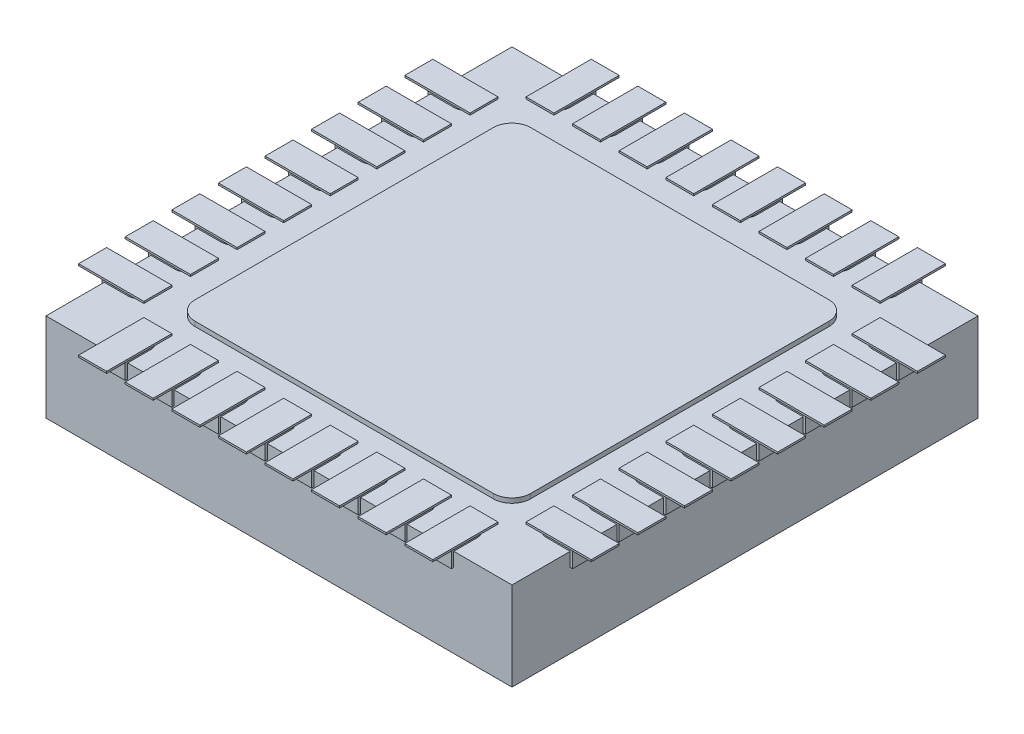
from build123d import *

# Parameters (mm, degrees)
SKETCH3_W                = 5
SKETCH3_H                = 5
BOSS_EXTRUDE2_DEPTH      = 0.95
BOSS_EXTRUDE3_DEPTH      = 0.05
BOSS_EXTRUDE3_DEPTH_BACK = 0.15
SKETCH4_W                = 0.3
SKETCH4_H                = 0.7
SKETCH4_W_2              = 0.7
SKETCH4_H_2              = 0.3
BOSS_EXTRUDE4_DEPTH      = 0.02
CUT_EXTRUDE1_DEPTH       = 0.05
CUT_EXTRUDE2_DEPTH       = 0.05
SKETCH7_R                = 0.3
CUT_EXTRUDE3_DEPTH       = 0.1


with BuildPart() as part:
    # Sketch3 → Boss-Extrude2 (new body)
    with BuildSketch(Plane(origin=(0, 0, 0), x_dir=(1, 0, 0), z_dir=(0, 1, 0))):
        Rectangle(SKETCH3_W, SKETCH3_H)
    extrude(amount=-BOSS_EXTRUDE2_DEPTH)

    # Sketch2 → Boss-Extrude3 (add, two sides: drawn at the far end of the back side and taken through both)
    with BuildSketch(Plane(origin=(0, 0, 0), x_dir=(1, 0, 0), z_dir=(0, 1, 0)).offset(-BOSS_EXTRUDE3_DEPTH_BACK)):
        with BuildLine():
            Line((-1.6, -1.8), (1.6, -1.8))
            ThreePointArc((1.6, -1.8), (1.741421356, -1.741421356), (1.8, -1.6))
            Line((1.8, -1.6), (1.8, 1.6))
            ThreePointArc((1.8, 1.6), (1.741421356, 1.741421356), (1.6, 1.8))
            Line((1.6, 1.8), (-1.6, 1.8))
            ThreePointArc((-1.6, 1.8), (-1.741421356, 1.741421356), (-1.8, 1.6))
            Line((-1.8, 1.6), (-1.8, -1.6))
            ThreePointArc((-1.8, -1.6), (-1.741421356, -1.741421356), (-1.6, -1.8))
        make_face()
        with BuildLine():
            Line((-1.875, -2.25), (-1.875, -2.525))
            Line((-1.875, -2.525), (-1.625, -2.525))
            Line((-1.625, -2.525), (-1.625, -2.25))
            ThreePointArc((-1.625, -2.25), (-1.75, -2.125), (-1.875, -2.25))
        make_face()
        with BuildLine():
            Line((-1.875, 2.25), (-1.875, 2.525))
            Line((-1.875, 2.525), (-1.625, 2.525))
            Line((-1.625, 2.525), (-1.625, 2.25))
            ThreePointArc((-1.625, 2.25), (-1.75, 2.125), (-1.875, 2.25))
        make_face()
        with BuildLine():
            Line((-1.375, -2.25), (-1.375, -2.525))
            Line((-1.375, -2.525), (-1.125, -2.525))
            Line((-1.125, -2.525), (-1.125, -2.25))
            ThreePointArc((-1.125, -2.25), (-1.25, -2.125), (-1.375, -2.25))
        make_face()
        with BuildLine():
            Line((-1.125, 2.525), (-1.125, 2.25))
            ThreePointArc((-1.125, 2.25), (-1.25, 2.125), (-1.375, 2.25))
            Line((-1.375, 2.25), (-1.375, 2.525))
            Line((-1.375, 2.525), (-1.125, 2.525))
        make_face()
        with BuildLine():
            Line((-0.875, -2.25), (-0.875, -2.525))
            Line((-0.875, -2.525), (-0.625, -2.525))
            Line((-0.625, -2.525), (-0.625, -2.25))
            ThreePointArc((-0.625, -2.25), (-0.75, -2.125), (-0.875, -2.25))
        make_face()
        with BuildLine():
            Line((-0.625, 2.525), (-0.625, 2.25))
            ThreePointArc((-0.625, 2.25), (-0.75, 2.125), (-0.875, 2.25))
            Line((-0.875, 2.25), (-0.875, 2.525))
            Line((-0.875, 2.525), (-0.625, 2.525))
        make_face()
        with BuildLine():
            Line((-0.375, -2.25), (-0.375, -2.525))
            Line((-0.375, -2.525), (-0.125, -2.525))
            Line((-0.125, -2.525), (-0.125, -2.25))
            ThreePointArc((-0.125, -2.25), (-0.25, -2.125), (-0.375, -2.25))
        make_face()
        with BuildLine():
            Line((-0.125, 2.525), (-0.125, 2.25))
            ThreePointArc((-0.125, 2.25), (-0.25, 2.125), (-0.375, 2.25))
            Line((-0.375, 2.25), (-0.375, 2.525))
            Line((-0.375, 2.525), (-0.125, 2.525))
        make_face()
        with BuildLine():
            Line((0.125, -2.25), (0.125, -2.525))
            Line((0.125, -2.525), (0.375, -2.525))
            Line((0.375, -2.525), (0.375, -2.25))
            ThreePointArc((0.375, -2.25), (0.25, -2.125), (0.125, -2.25))
        make_face()
        with BuildLine():
            Line((0.375, 2.525), (0.375, 2.25))
            ThreePointArc((0.375, 2.25), (0.25, 2.125), (0.125, 2.25))
            Line((0.125, 2.25), (0.125, 2.525))
            Line((0.125, 2.525), (0.375, 2.525))
        make_face()
        with BuildLine():
            Line((0.625, -2.25), (0.625, -2.525))
            Line((0.625, -2.525), (0.875, -2.525))
            Line((0.875, -2.525), (0.875, -2.25))
            ThreePointArc((0.875, -2.25), (0.75, -2.125), (0.625, -2.25))
        make_face()
        with BuildLine():
            Line((0.875, 2.525), (0.875, 2.25))
            ThreePointArc((0.875, 2.25), (0.75, 2.125), (0.625, 2.25))
            Line((0.625, 2.25), (0.625, 2.525))
            Line((0.625, 2.525), (0.875, 2.525))
        make_face()
        with BuildLine():
            Line((1.125, -2.25), (1.125, -2.525))
            Line((1.125, -2.525), (1.375, -2.525))
            Line((1.375, -2.525), (1.375, -2.25))
            ThreePointArc((1.375, -2.25), (1.25, -2.125), (1.125, -2.25))
        make_face()
        with BuildLine():
            Line((1.375, 2.525), (1.375, 2.25))
            ThreePointArc((1.375, 2.25), (1.25, 2.125), (1.125, 2.25))
            Line((1.125, 2.25), (1.125, 2.525))
            Line((1.125, 2.525), (1.375, 2.525))
        make_face()
        with BuildLine():
            Line((1.625, -2.25), (1.625, -2.525))
            Line((1.625, -2.525), (1.875, -2.525))
            Line((1.875, -2.525), (1.875, -2.25))
            ThreePointArc((1.875, -2.25), (1.75, -2.125), (1.625, -2.25))
        make_face()
        with BuildLine():
            Line((1.875, 2.525), (1.875, 2.25))
            ThreePointArc((1.875, 2.25), (1.75, 2.125), (1.625, 2.25))
            Line((1.625, 2.25), (1.625, 2.525))
            Line((1.625, 2.525), (1.875, 2.525))
        make_face()
        with BuildLine():
            Line((-2.525, -1.875), (-2.245, -1.875))
            ThreePointArc((-2.245, -1.875), (-2.12, -1.75), (-2.245, -1.625))
            Line((-2.245, -1.625), (-2.525, -1.625))
            Line((-2.525, -1.625), (-2.525, -1.875))
        make_face()
        with BuildLine():
            Line((2.245, -1.875), (2.525, -1.875))
            Line((2.525, -1.875), (2.525, -1.625))
            Line((2.525, -1.625), (2.245, -1.625))
            ThreePointArc((2.245, -1.625), (2.12, -1.75), (2.245, -1.875))
        make_face()
        with BuildLine():
            Line((-2.245, -1.125), (-2.525, -1.125))
            Line((-2.525, -1.125), (-2.525, -1.375))
            Line((-2.525, -1.375), (-2.245, -1.375))
            ThreePointArc((-2.245, -1.375), (-2.12, -1.25), (-2.245, -1.125))
        make_face()
        with BuildLine():
            Line((2.245, -1.375), (2.525, -1.375))
            Line((2.525, -1.375), (2.525, -1.125))
            Line((2.525, -1.125), (2.245, -1.125))
            ThreePointArc((2.245, -1.125), (2.12, -1.25), (2.245, -1.375))
        make_face()
        with BuildLine():
            Line((-2.245, -0.625), (-2.525, -0.625))
            Line((-2.525, -0.625), (-2.525, -0.875))
            Line((-2.525, -0.875), (-2.245, -0.875))
            ThreePointArc((-2.245, -0.875), (-2.12, -0.75), (-2.245, -0.625))
        make_face()
        with BuildLine():
            Line((2.245, -0.875), (2.525, -0.875))
            Line((2.525, -0.875), (2.525, -0.625))
            Line((2.525, -0.625), (2.245, -0.625))
            ThreePointArc((2.245, -0.625), (2.12, -0.75), (2.245, -0.875))
        make_face()
        with BuildLine():
            Line((-2.245, -0.125), (-2.525, -0.125))
            Line((-2.525, -0.125), (-2.525, -0.375))
            Line((-2.525, -0.375), (-2.245, -0.375))
            ThreePointArc((-2.245, -0.375), (-2.12, -0.25), (-2.245, -0.125))
        make_face()
        with BuildLine():
            Line((2.245, -0.375), (2.525, -0.375))
            Line((2.525, -0.375), (2.525, -0.125))
            Line((2.525, -0.125), (2.245, -0.125))
            ThreePointArc((2.245, -0.125), (2.12, -0.25), (2.245, -0.375))
        make_face()
        with BuildLine():
            Line((-2.245, 0.375), (-2.525, 0.375))
            Line((-2.525, 0.375), (-2.525, 0.125))
            Line((-2.525, 0.125), (-2.245, 0.125))
            ThreePointArc((-2.245, 0.125), (-2.12, 0.25), (-2.245, 0.375))
        make_face()
        with BuildLine():
            Line((2.245, 0.125), (2.525, 0.125))
            Line((2.525, 0.125), (2.525, 0.375))
            Line((2.525, 0.375), (2.245, 0.375))
            ThreePointArc((2.245, 0.375), (2.12, 0.25), (2.245, 0.125))
        make_face()
        with BuildLine():
            Line((-2.245, 0.875), (-2.525, 0.875))
            Line((-2.525, 0.875), (-2.525, 0.625))
            Line((-2.525, 0.625), (-2.245, 0.625))
            ThreePointArc((-2.245, 0.625), (-2.12, 0.75), (-2.245, 0.875))
        make_face()
        with BuildLine():
            Line((2.245, 0.625), (2.525, 0.625))
            Line((2.525, 0.625), (2.525, 0.875))
            Line((2.525, 0.875), (2.245, 0.875))
            ThreePointArc((2.245, 0.875), (2.12, 0.75), (2.245, 0.625))
        make_face()
        with BuildLine():
            Line((-2.245, 1.375), (-2.525, 1.375))
            Line((-2.525, 1.375), (-2.525, 1.125))
            Line((-2.525, 1.125), (-2.245, 1.125))
            ThreePointArc((-2.245, 1.125), (-2.12, 1.25), (-2.245, 1.375))
        make_face()
        with BuildLine():
            Line((2.245, 1.125), (2.525, 1.125))
            Line((2.525, 1.125), (2.525, 1.375))
            Line((2.525, 1.375), (2.245, 1.375))
            ThreePointArc((2.245, 1.375), (2.12, 1.25), (2.245, 1.125))
        make_face()
        with BuildLine():
            Line((-2.245, 1.875), (-2.525, 1.875))
            Line((-2.525, 1.875), (-2.525, 1.625))
            Line((-2.525, 1.625), (-2.245, 1.625))
            ThreePointArc((-2.245, 1.625), (-2.12, 1.75), (-2.245, 1.875))
        make_face()
        with BuildLine():
            Line((2.245, 1.625), (2.525, 1.625))
            Line((2.525, 1.625), (2.525, 1.875))
            Line((2.525, 1.875), (2.245, 1.875))
            ThreePointArc((2.245, 1.875), (2.12, 1.75), (2.245, 1.625))
        make_face()
    extrude(amount=BOSS_EXTRUDE3_DEPTH + BOSS_EXTRUDE3_DEPTH_BACK)

    # Sketch4 → Boss-Extrude4 (add)
    with BuildSketch(Plane(origin=(0, 0.06, 0), x_dir=(1, 0, 0), z_dir=(0, 1, 0))):
        with Locations((-1.75, 2.4)):
            Rectangle(SKETCH4_W, SKETCH4_H)
        with Locations((-1.75, -2.4)):
            Rectangle(SKETCH4_W, SKETCH4_H)
        with Locations((-1.25, -2.4)):
            Rectangle(SKETCH4_W, SKETCH4_H)
        with Locations((-1.25, 2.4)):
            Rectangle(SKETCH4_W, SKETCH4_H)
        with Locations((-0.75, -2.4)):
            Rectangle(SKETCH4_W, SKETCH4_H)
        with Locations((-0.75, 2.4)):
            Rectangle(SKETCH4_W, SKETCH4_H)
        with Locations((-0.25, -2.4)):
            Rectangle(SKETCH4_W, SKETCH4_H)
        with Locations((-0.25, 2.4)):
            Rectangle(SKETCH4_W, SKETCH4_H)
        with Locations((0.25, -2.4)):
            Rectangle(SKETCH4_W, SKETCH4_H)
        with Locations((0.25, 2.4)):
            Rectangle(SKETCH4_W, SKETCH4_H)
        with Locations((0.75, -2.4)):
            Rectangle(SKETCH4_W, SKETCH4_H)
        with Locations((0.75, 2.4)):
            Rectangle(SKETCH4_W, SKETCH4_H)
        with Locations((1.25, -2.4)):
            Rectangle(SKETCH4_W, SKETCH4_H)
        with Locations((1.25, 2.4)):
            Rectangle(SKETCH4_W, SKETCH4_H)
        with Locations((1.75, -2.4)):
            Rectangle(SKETCH4_W, SKETCH4_H)
        with Locations((1.75, 2.4)):
            Rectangle(SKETCH4_W, SKETCH4_H)
        with Locations((-2.4, 1.25)):
            Rectangle(SKETCH4_W_2, SKETCH4_H_2)
        with Locations((-2.4, 1.75)):
            Rectangle(SKETCH4_W_2, SKETCH4_H_2)
        with Locations((2.4, 1.75)):
            Rectangle(SKETCH4_W_2, SKETCH4_H_2)
        with Locations((2.4, 1.25)):
            Rectangle(SKETCH4_W_2, SKETCH4_H_2)
        with Locations((-2.4, 0.75)):
            Rectangle(SKETCH4_W_2, SKETCH4_H_2)
        with Locations((2.4, 0.75)):
            Rectangle(SKETCH4_W_2, SKETCH4_H_2)
        with Locations((-2.4, 0.25)):
            Rectangle(SKETCH4_W_2, SKETCH4_H_2)
        with Locations((2.4, 0.25)):
            Rectangle(SKETCH4_W_2, SKETCH4_H_2)
        with Locations((-2.4, -0.25)):
            Rectangle(SKETCH4_W_2, SKETCH4_H_2)
        with Locations((2.4, -0.25)):
            Rectangle(SKETCH4_W_2, SKETCH4_H_2)
        with Locations((-2.4, -0.75)):
            Rectangle(SKETCH4_W_2, SKETCH4_H_2)
        with Locations((2.4, -0.75)):
            Rectangle(SKETCH4_W_2, SKETCH4_H_2)
        with Locations((-2.4, -1.25)):
            Rectangle(SKETCH4_W_2, SKETCH4_H_2)
        with Locations((2.4, -1.25)):
            Rectangle(SKETCH4_W_2, SKETCH4_H_2)
        with Locations((-2.4, -1.75)):
            Rectangle(SKETCH4_W_2, SKETCH4_H_2)
        with Locations((2.4, -1.75)):
            Rectangle(SKETCH4_W_2, SKETCH4_H_2)
    extrude(amount=-BOSS_EXTRUDE4_DEPTH)

    # Sketch6 → Cut-Extrude1 (cut)
    # profile 1 of 20: a face of its own
    with BuildSketch(Plane.XZ.offset(0.95)):
        with BuildLine():
            Line((1.210072545, -0.426367187), (1.064592634, -0.012639509))
            Line((1.064592634, -0.012639509), (1.062751116, -0.014890253))
            Line((1.062751116, -0.014890253), (0.916145833, -0.431687128))
            add(Edge.make_bspline(
                [(0.916145833, -0.431687128), (0.914718843, -0.433195507), (0.911946157, -0.436126332), (0.907954699, -0.436650407), (0.906017485, -0.436904762)],
                knots=[0, 0, 0, 0, 1.029320271, 2, 2, 2, 2], degree=3))
            add(Edge.make_bspline(
                [(0.906017485, -0.436904762), (0.905154079, -0.436892571), (0.903713584, -0.436872232), (0.902363704, -0.43638415), (0.901822917, -0.436188616)],
                knots=[0, 0, 0, 0, 1.198762811, 2, 2, 2, 2], degree=3))
            add(Edge.make_bspline(
                [(0.901822917, -0.436188616), (0.900869614, -0.435761974), (0.899028649, -0.434938066), (0.896791587, -0.432829363), (0.894994979, -0.430273177), (0.894369178, -0.42823363), (0.894047619, -0.42718564)],
                knots=[0, 0, 0, 0, 1.006089285, 1.94290214, 2.942991381, 4, 4, 4, 4], degree=3))
            Line((0.894047619, -0.42718564), (0.894047619, -0.409281994))
            Line((0.894047619, -0.409281994), (0.894047619, 0.101841518))
            add(Edge.make_bspline(
                [(0.894047619, 0.101841518), (0.894307658, 0.103015073), (0.894815685, 0.105307795), (0.896366888, 0.108472325), (0.898698603, 0.11106287), (0.900568522, 0.112411764), (0.901515997, 0.113095238)],
                knots=[0, 0, 0, 0, 1.032778835, 2.01769381, 2.995579864, 4, 4, 4, 4], degree=3))
            Line((0.901515997, 0.113095238), (0.931184896, 0.113095238))
            add(Edge.make_bspline(
                [(0.931184896, 0.113095238), (0.93199492, 0.112801051), (0.933652722, 0.112198964), (0.935716727, 0.110358474), (0.937393343, 0.107873869), (0.93821062, 0.105951766), (0.938653274, 0.104910714)],
                knots=[0, 0, 0, 0, 0.892106066, 1.825791923, 2.822403661, 4, 4, 4, 4], degree=3))
            Line((0.938653274, 0.104910714), (0.939880952, 0.097544643))
            Line((0.939880952, 0.097544643), (0.939880952, -0.218480283))
            Line((0.939880952, -0.218480283), (1.053952753, 0.106445313))
            add(Edge.make_bspline(
                [(1.053952753, 0.106445313), (1.05474302, 0.107424703), (1.05623294, 0.109271186), (1.058784299, 0.11152962), (1.061650518, 0.112842399), (1.063626304, 0.113012194), (1.064592634, 0.113095238)],
                knots=[0, 0, 0, 0, 1.158246252, 2.183685773, 3.111665676, 4, 4, 4, 4], degree=3))
            add(Edge.make_bspline(
                [(1.064592634, 0.113095238), (1.065983442, 0.112994588), (1.068713519, 0.112797018), (1.072411525, 0.110659769), (1.075254922, 0.107188697), (1.076372759, 0.104306589), (1.076971726, 0.102762277)],
                knots=[0, 0, 0, 0, 0.953966103, 1.872582269, 2.860071235, 4, 4, 4, 4], degree=3))
            Line((1.076971726, 0.102762277), (1.188690476, -0.218480283))
            Line((1.188690476, -0.218480283), (1.188690476, 0.102762277))
            add(Edge.make_bspline(
                [(1.188690476, 0.102762277), (1.189515599, 0.104678443), (1.191023597, 0.108180439), (1.194976664, 0.111207936), (1.19868678, 0.112141911), (1.202132364, 0.112803581), (1.206318974, 0.113032539), (1.209356785, 0.113073287), (1.210993304, 0.113095238)],
                knots=[0, 0, 0, 0, 1.387598353, 2.535982921, 3.182758982, 3.953118769, 4.897311594, 6, 6, 6, 6], degree=3))
            Line((1.210993304, 0.113095238), (1.226441592, 0.113095238))
            add(Edge.make_bspline(
                [(1.226441592, 0.113095238), (1.228061618, 0.112005121), (1.231683157, 0.109568184), (1.233512686, 0.105580169), (1.23452381, 0.103376116)],
                knots=[0, 0, 0, 0, 0.894661657, 2, 2, 2, 2], degree=3))
            Line((1.23452381, 0.103376116), (1.23452381, 0.090690104))
            Line((1.23452381, 0.090690104), (1.23452381, -0.424934896))
            add(Edge.make_bspline(
                [(1.23452381, -0.424934896), (1.234132704, -0.42621927), (1.23340636, -0.428604558), (1.231610703, -0.431654497), (1.229471474, -0.434067038), (1.227637947, -0.434944507), (1.226748512, -0.435370164)],
                knots=[0, 0, 0, 0, 1.189307796, 2.20873289, 3.131064228, 4, 4, 4, 4], degree=3))
            add(Edge.make_bspline(
                [(1.226748512, -0.435370164), (1.225947638, -0.435805104), (1.224288753, -0.436706014), (1.222403609, -0.436837009), (1.221428571, -0.436904762)],
                knots=[0, 0, 0, 0, 0.965557051, 2, 2, 2, 2], degree=3))
            add(Edge.make_bspline(
                [(1.221428571, -0.436904762), (1.220449455, -0.436771847), (1.218455458, -0.436501164), (1.215589214, -0.434531655), (1.212907309, -0.430995295), (1.211129676, -0.428093086), (1.210072545, -0.426367187)],
                knots=[0, 0, 0, 0, 0.724309195, 1.475075939, 2.498466512, 4, 4, 4, 4], degree=3))
        make_face()
    # profile 2 of 20: a face of its own
    with BuildSketch(Plane.XZ.offset(0.95)):
        with BuildLine():
            add(Edge.make_bspline(
                [(0.510500372, -0.43608631), (0.50976656, -0.43600872), (0.508290157, -0.435852613), (0.506287826, -0.434471449), (0.504930386, -0.432181832), (0.503286734, -0.427891389), (0.502406658, -0.420663372), (0.502283142, -0.414496288), (0.502213542, -0.411021205)],
                knots=[0, 0, 0, 0, 0.458930941, 0.92335228, 1.465177174, 2.111000206, 3.808592728, 6, 6, 6, 6], degree=3))
            Line((0.502213542, -0.411021205), (0.502213542, -0.390559896))
            add(Edge.make_bspline(
                [(0.502213542, -0.390559896), (0.502871789, -0.388157467), (0.504087804, -0.383719338), (0.507642301, -0.38083417), (0.509272693, -0.379510789)],
                knots=[0, 0, 0, 0, 1.082630928, 2, 2, 2, 2], degree=3))
            Line((0.509272693, -0.379510789), (0.515206473, -0.37797619))
            Line((0.515206473, -0.37797619), (0.717261905, -0.37797619))
            Line((0.717261905, -0.37797619), (0.717261905, -0.188095238))
            Line((0.717261905, -0.188095238), (0.609123884, -0.188095238))
            add(Edge.make_bspline(
                [(0.609123884, -0.188095238), (0.608410785, -0.187874012), (0.606831251, -0.18738399), (0.60498413, -0.185327923), (0.603044835, -0.182693276), (0.602023692, -0.180517407), (0.601450893, -0.179296875)],
                knots=[0, 0, 0, 0, 0.730957828, 1.619092074, 2.664453419, 4, 4, 4, 4], degree=3))
            add(Edge.make_bspline(
                [(0.601450893, -0.179296875), (0.601261204, -0.178105415), (0.600840252, -0.17546135), (0.600614863, -0.171079756), (0.600390757, -0.165931207), (0.60034831, -0.16224623), (0.600325521, -0.160267857)],
                knots=[0, 0, 0, 0, 0.758257029, 1.682708873, 2.755903774, 4, 4, 4, 4], degree=3))
            add(Edge.make_bspline(
                [(0.600325521, -0.160267857), (0.600321003, -0.157948875), (0.600312699, -0.153685742), (0.600363407, -0.147920999), (0.60065606, -0.143350147), (0.600693743, -0.138942878), (0.60241447, -0.134012325), (0.605672051, -0.131909237), (0.607384673, -0.130803571)],
                knots=[0, 0, 0, 0, 1.303816242, 2.396889211, 3.2414061, 3.875301435, 4.882973714, 6, 6, 6, 6], degree=3))
            Line((0.607384673, -0.130803571), (0.613216146, -0.129166667))
            Line((0.613216146, -0.129166667), (0.717261905, -0.129166667))
            Line((0.717261905, -0.129166667), (0.717261905, 0.054166667))
            Line((0.717261905, 0.054166667), (0.510500372, 0.054166667))
            add(Edge.make_bspline(
                [(0.510500372, 0.054166667), (0.509582403, 0.054632261), (0.507712945, 0.055580449), (0.505452379, 0.057901975), (0.503732918, 0.060930675), (0.503144368, 0.063250303), (0.502827381, 0.064499628)],
                knots=[0, 0, 0, 0, 0.916389236, 1.866239751, 2.850781764, 4, 4, 4, 4], degree=3))
            add(Edge.make_bspline(
                [(0.502827381, 0.064499628), (0.502705432, 0.066749831), (0.502432117, 0.071793066), (0.502469655, 0.080154194), (0.502131892, 0.090108619), (0.502184979, 0.09727146), (0.502213542, 0.101125372)],
                knots=[0, 0, 0, 0, 0.737996034, 1.654022555, 2.737764626, 4, 4, 4, 4], degree=3))
            add(Edge.make_bspline(
                [(0.502213542, 0.101125372), (0.502995972, 0.103481627), (0.504390435, 0.107680991), (0.507427977, 0.110874951), (0.508761161, 0.112276786)],
                knots=[0, 0, 0, 0, 1.122196084, 2, 2, 2, 2], degree=3))
            Line((0.508761161, 0.112276786), (0.512955729, 0.113095238))
            Line((0.512955729, 0.113095238), (0.75531994, 0.113095238))
            add(Edge.make_bspline(
                [(0.75531994, 0.113095238), (0.756910538, 0.112005267), (0.76046562, 0.109569116), (0.762159323, 0.105580284), (0.763095238, 0.103376116)],
                knots=[0, 0, 0, 0, 0.894830418, 2, 2, 2, 2], degree=3))
            Line((0.763095238, 0.103376116), (0.763095238, 0.090690104))
            Line((0.763095238, 0.090690104), (0.763095238, -0.425651042))
            add(Edge.make_bspline(
                [(0.763095238, -0.425651042), (0.762754241, -0.426940661), (0.76208983, -0.429453405), (0.759961248, -0.432695665), (0.757091738, -0.435267652), (0.754775349, -0.436347736), (0.753580729, -0.436904762)],
                knots=[0, 0, 0, 0, 1.034608711, 2.015872402, 2.976736403, 4, 4, 4, 4], degree=3))
            Line((0.753580729, -0.436904762), (0.510500372, -0.43608631))
        make_face()
    # profile 3 of 20: a face of its own
    with BuildSketch(Plane.XZ.offset(0.95)):
        with BuildLine():
            Line((0.151302083, -0.40733817), (0.109561012, -0.353422619))
            Line((0.109561012, -0.353422619), (0.088690476, -0.29797247))
            add(Edge.make_bspline(
                [(0.088690476, -0.29797247), (0.088708326, -0.295342211), (0.08873854, -0.290889903), (0.090374168, -0.286768483), (0.091043527, -0.285081845)],
                knots=[0, 0, 0, 0, 1.181526168, 2, 2, 2, 2], degree=3))
            add(Edge.make_bspline(
                [(0.091043527, -0.285081845), (0.091989602, -0.284044334), (0.093837993, -0.282017301), (0.097377805, -0.279791456), (0.101446936, -0.278410533), (0.10436592, -0.278289831), (0.105877976, -0.278227307)],
                knots=[0, 0, 0, 0, 0.991719859, 1.937568686, 2.931644178, 4, 4, 4, 4], degree=3))
            add(Edge.make_bspline(
                [(0.105877976, -0.278227307), (0.106867873, -0.278285957), (0.109572659, -0.278446215), (0.114197055, -0.279091033), (0.119558776, -0.279756281), (0.123987075, -0.280205959), (0.127274585, -0.281044088), (0.129255907, -0.282738391), (0.130923426, -0.285057599), (0.131667528, -0.286934921), (0.132068452, -0.287946429)],
                knots=[0, 0, 0, 0, 0.792010749, 2.164084151, 3.728773214, 5.104358871, 5.733381581, 6.392937359, 7.134108636, 8, 8, 8, 8], degree=3))
            Line((0.132068452, -0.287946429), (0.149869792, -0.334802827))
            Line((0.149869792, -0.334802827), (0.16889881, -0.357105655))
            Line((0.16889881, -0.357105655), (0.202762277, -0.37797619))
            Line((0.202762277, -0.37797619), (0.275195313, -0.37797619))
            Line((0.275195313, -0.37797619), (0.310184152, -0.355877976))
            Line((0.310184152, -0.355877976), (0.327473958, -0.333779762))
            add(Edge.make_bspline(
                [(0.327473958, -0.333779762), (0.32889894, -0.330619677), (0.33193553, -0.323885635), (0.33620276, -0.312881203), (0.340541846, -0.300442573), (0.345090222, -0.286617449), (0.349503243, -0.271323856), (0.35428068, -0.254684861), (0.35891103, -0.236536016), (0.362058492, -0.223971842), (0.363690476, -0.217457217)],
                knots=[0, 0, 0, 0, 0.681852536, 1.453006361, 2.320821465, 3.273390224, 4.315664321, 5.451898179, 6.67878895, 8, 8, 8, 8], degree=3))
            Line((0.363690476, -0.217457217), (0.363690476, -0.101953125))
            add(Edge.make_bspline(
                [(0.363690476, -0.101953125), (0.362597326, -0.098031905), (0.360535533, -0.090636081), (0.357649109, -0.080172478), (0.3551912, -0.070922241), (0.353095202, -0.062928146), (0.351213535, -0.056186715), (0.349673162, -0.050707273), (0.348543598, -0.046444693), (0.347965927, -0.04401437), (0.347730655, -0.043024554)],
                knots=[0, 0, 0, 0, 1.60019962, 3.018140744, 4.266793676, 5.362603539, 6.266752397, 7.018056806, 7.600076455, 8, 8, 8, 8], degree=3))
            add(Edge.make_bspline(
                [(0.347730655, -0.043024554), (0.345991144, -0.037795037), (0.342620056, -0.027660488), (0.337159435, -0.013105391), (0.331710768, 0.000357682), (0.327810881, 0.008857934), (0.32593936, 0.012937128)],
                knots=[0, 0, 0, 0, 1.100461683, 2.132641582, 3.103871418, 4, 4, 4, 4], degree=3))
            Line((0.32593936, 0.012937128), (0.30875186, 0.033603051))
            Line((0.30875186, 0.033603051), (0.274479167, 0.054166667))
            Line((0.274479167, 0.054166667), (0.203069196, 0.054166667))
            Line((0.203069196, 0.054166667), (0.167568824, 0.032375372))
            Line((0.167568824, 0.032375372), (0.15109747, 0.010481771))
            Line((0.15109747, 0.010481771), (0.13452381, -0.030952381))
            Line((0.13452381, -0.030952381), (0.13452381, -0.083333333))
            Line((0.13452381, -0.083333333), (0.20327381, -0.083333333))
            add(Edge.make_bspline(
                [(0.20327381, -0.083333333), (0.205071268, -0.08423417), (0.208562737, -0.085984), (0.210236851, -0.089503383), (0.211049107, -0.091210938)],
                knots=[0, 0, 0, 0, 1.029628582, 2, 2, 2, 2], degree=3))
            Line((0.211049107, -0.091210938), (0.212788318, -0.095917039))
            Line((0.212788318, -0.095917039), (0.212174479, -0.130496652))
            add(Edge.make_bspline(
                [(0.212174479, -0.130496652), (0.211845763, -0.131707546), (0.21123244, -0.133966845), (0.20965754, -0.136948044), (0.207612773, -0.139303561), (0.20586525, -0.140260586), (0.205013021, -0.140727307)],
                knots=[0, 0, 0, 0, 1.16021269, 2.164737494, 3.104982886, 4, 4, 4, 4], degree=3))
            Line((0.205013021, -0.140727307), (0.198976935, -0.142261905))
            Line((0.198976935, -0.142261905), (0.097693452, -0.142261905))
            add(Edge.make_bspline(
                [(0.097693452, -0.142261905), (0.095697891, -0.141171637), (0.091891045, -0.139091782), (0.090138277, -0.135139439), (0.089304315, -0.133258929)],
                knots=[0, 0, 0, 0, 1.048407128, 2, 2, 2, 2], degree=3))
            Line((0.089304315, -0.133258929), (0.088690476, -0.124972098))
            Line((0.088690476, -0.124972098), (0.088690476, -0.022051711))
            Line((0.088690476, -0.022051711), (0.11140253, 0.03421689))
            Line((0.11140253, 0.03421689), (0.153655134, 0.08608631))
            Line((0.153655134, 0.08608631), (0.196623884, 0.113095238))
            Line((0.196623884, 0.113095238), (0.282459077, 0.113095238))
            Line((0.282459077, 0.113095238), (0.326655506, 0.08547247))
            Line((0.326655506, 0.08547247), (0.369010417, 0.031659226))
            Line((0.369010417, 0.031659226), (0.390392485, -0.024404762))
            Line((0.390392485, -0.024404762), (0.40952381, -0.09765625))
            Line((0.40952381, -0.09765625), (0.40952381, -0.227687872))
            Line((0.40952381, -0.227687872), (0.388039435, -0.306156994))
            Line((0.388039435, -0.306156994), (0.367782738, -0.356184896))
            Line((0.367782738, -0.356184896), (0.323688616, -0.40999814))
            Line((0.323688616, -0.40999814), (0.282459077, -0.436188616))
            Line((0.282459077, -0.436188616), (0.279492187, -0.436904762))
            Line((0.279492187, -0.436904762), (0.195396205, -0.436188616))
            Line((0.195396205, -0.436188616), (0.151302083, -0.40733817))
        make_face()
    # profile 4 of 20: a face of its own
    with BuildSketch(Plane.XZ.offset(0.95)):
        with BuildLine():
            Line((-0.165745908, -0.42718564), (-0.323809524, 0.095191592))
            add(Edge.make_bspline(
                [(-0.323809524, 0.095191592), (-0.323778767, 0.096695137), (-0.323721837, 0.099478221), (-0.323103456, 0.103329367), (-0.322163083, 0.106522049), (-0.320645342, 0.109085381), (-0.318504059, 0.11104534), (-0.315539873, 0.11221671), (-0.311922958, 0.11307283), (-0.309220754, 0.113087331), (-0.307747396, 0.113095238)],
                knots=[0, 0, 0, 0, 1.274690765, 2.359471932, 3.302146231, 4.081389353, 4.860094881, 5.715183441, 6.754219054, 8, 8, 8, 8], degree=3))
            Line((-0.307747396, 0.113095238), (-0.288002232, 0.113095238))
            add(Edge.make_bspline(
                [(-0.288002232, 0.113095238), (-0.286470336, 0.112170973), (-0.283233978, 0.110218327), (-0.281331304, 0.106942751), (-0.280329241, 0.105217634)],
                knots=[0, 0, 0, 0, 0.946678752, 2, 2, 2, 2], degree=3))
            Line((-0.280329241, 0.105217634), (-0.245135789, -0.004761905))
            Line((-0.245135789, -0.004761905), (-0.062620908, -0.004761905))
            Line((-0.062620908, -0.004761905), (-0.026302083, 0.106752232))
            add(Edge.make_bspline(
                [(-0.026302083, 0.106752232), (-0.025461496, 0.107724355), (-0.023755559, 0.109697238), (-0.020325889, 0.111714519), (-0.016316629, 0.112882909), (-0.013488541, 0.113021351), (-0.011979167, 0.113095238)],
                knots=[0, 0, 0, 0, 0.943850325, 1.915505833, 2.887487564, 4, 4, 4, 4], degree=3))
            add(Edge.make_bspline(
                [(-0.011979167, 0.113095238), (-0.010853795, 0.113095238), (-0.008057416, 0.113095238), (-0.005261037, 0.113095238), (-0.00359003, 0.113095238)],
                knots=[0, 0, 0, 0, 0.804878049, 2, 2, 2, 2], degree=3))
            add(Edge.make_bspline(
                [(-0.00359003, 0.113095238), (-0.001543899, 0.113095238), (0.002241443, 0.113095238), (0.006026786, 0.113095238), (0.007765997, 0.113095238)],
                knots=[0, 0, 0, 0, 1.081081081, 2, 2, 2, 2], degree=3))
            add(Edge.make_bspline(
                [(0.007765997, 0.113095238), (0.009131706, 0.112703822), (0.011822001, 0.111932777), (0.014799834, 0.108491865), (0.016516434, 0.103768895), (0.016613208, 0.100154879), (0.016666667, 0.098158482)],
                knots=[0, 0, 0, 0, 0.879221665, 1.731968348, 2.747130038, 4, 4, 4, 4], degree=3))
            add(Edge.make_bspline(
                [(0.016666667, 0.098158482), (0.016679659, 0.097061982), (0.016703396, 0.095058693), (0.016255546, 0.093107782), (0.016052827, 0.092224702)],
                knots=[0, 0, 0, 0, 1.094700372, 2, 2, 2, 2], degree=3))
            Line((0.016052827, 0.092224702), (-0.143136161, -0.429436384))
            add(Edge.make_bspline(
                [(-0.143136161, -0.429436384), (-0.143808369, -0.430559087), (-0.14505183, -0.432635878), (-0.147399565, -0.435066221), (-0.149985877, -0.436540252), (-0.151782825, -0.436786052), (-0.15265067, -0.436904762)],
                knots=[0, 0, 0, 0, 1.238763462, 2.291482334, 3.174862637, 4, 4, 4, 4], degree=3))
            add(Edge.make_bspline(
                [(-0.15265067, -0.436904762), (-0.154074543, -0.436799875), (-0.156850836, -0.436595365), (-0.160594791, -0.434572259), (-0.163752006, -0.431441614), (-0.165047877, -0.428675583), (-0.165745908, -0.42718564)],
                knots=[0, 0, 0, 0, 0.976753616, 1.904492135, 2.87123923, 4, 4, 4, 4], degree=3))
        make_face()
        Polygon((-0.080217634, -0.063690476), (-0.22641369, -0.063690476), (-0.153366815, -0.299813988), align=None, mode=Mode.SUBTRACT)
    # profile 5 of 20: a face of its own
    with BuildSketch(Plane.XZ.offset(0.95)):
        with BuildLine():
            add(Edge.make_bspline(
                [(-0.581212798, -0.432096354), (-0.582524585, -0.430253005), (-0.585306288, -0.4263441), (-0.585573228, -0.421539813), (-0.585714286, -0.419001116)],
                knots=[0, 0, 0, 0, 0.943153724, 2, 2, 2, 2], degree=3))
            Line((-0.585714286, -0.419001116), (-0.585714286, 0.10265997))
            add(Edge.make_bspline(
                [(-0.585714286, 0.10265997), (-0.584969276, 0.104930427), (-0.583556688, 0.109235368), (-0.5798808, 0.111856506), (-0.578143601, 0.113095238)],
                knots=[0, 0, 0, 0, 1.05481425, 2, 2, 2, 2], degree=3))
            Line((-0.578143601, 0.113095238), (-0.548065476, 0.113095238))
            add(Edge.make_bspline(
                [(-0.548065476, 0.113095238), (-0.547083461, 0.112665586), (-0.545145323, 0.11181761), (-0.542687497, 0.109685091), (-0.540934557, 0.106806234), (-0.540243185, 0.104622535), (-0.539880952, 0.103478423)],
                knots=[0, 0, 0, 0, 0.972168258, 1.918702339, 2.909539504, 4, 4, 4, 4], degree=3))
            Line((-0.539880952, 0.103478423), (-0.539880952, 0.088643973))
            Line((-0.539880952, 0.088643973), (-0.539880952, -0.330403646))
            Line((-0.539880952, -0.330403646), (-0.519828869, -0.305747768))
            Line((-0.519828869, -0.305747768), (-0.476655506, -0.279659598))
            add(Edge.make_bspline(
                [(-0.476655506, -0.279659598), (-0.475357333, -0.279727284), (-0.472976829, -0.279851401), (-0.469639046, -0.280521626), (-0.466937163, -0.281870255), (-0.464594676, -0.283873194), (-0.463005933, -0.287323324), (-0.462070591, -0.292264332), (-0.461346364, -0.299010329), (-0.461322785, -0.304108299), (-0.461309524, -0.306975446)],
                knots=[0, 0, 0, 0, 0.853787321, 1.565619441, 2.216715773, 2.819394937, 3.550694807, 4.653687831, 6.118001623, 8, 8, 8, 8], degree=3))
            Line((-0.461309524, -0.306975446), (-0.461309524, -0.315364583))
            add(Edge.make_bspline(
                [(-0.461309524, -0.315364583), (-0.461375273, -0.317555099), (-0.461496739, -0.321601928), (-0.462660667, -0.327063956), (-0.464670019, -0.331488131), (-0.466832146, -0.333459186), (-0.467857143, -0.334393601)],
                knots=[0, 0, 0, 0, 1.260445817, 2.328588702, 3.207636775, 4, 4, 4, 4], degree=3))
            Line((-0.467857143, -0.334393601), (-0.506119792, -0.358640253))
            Line((-0.506119792, -0.358640253), (-0.566582961, -0.434654018))
            add(Edge.make_bspline(
                [(-0.566582961, -0.434654018), (-0.567332606, -0.435284373), (-0.569032372, -0.436713658), (-0.571267416, -0.436836241), (-0.572516741, -0.436904762)],
                knots=[0, 0, 0, 0, 0.882057335, 2, 2, 2, 2], degree=3))
            add(Edge.make_bspline(
                [(-0.572516741, -0.436904762), (-0.574010067, -0.436612559), (-0.577398865, -0.435949463), (-0.579844737, -0.433478468), (-0.581212798, -0.432096354)],
                knots=[0, 0, 0, 0, 0.881330785, 2, 2, 2, 2], degree=3))
        make_face()
    # profile 6 of 20: a face of its own
    with BuildSketch(Plane.XZ.offset(0.95)):
        with BuildLine():
            Line((-1.043024554, -0.409384301), (-1.048446801, -0.403245908))
            Line((-1.048446801, -0.403245908), (-1.06860119, -0.349637277))
            add(Edge.make_bspline(
                [(-1.06860119, -0.349637277), (-1.068755787, -0.348923422), (-1.069142251, -0.347138916), (-1.069187739, -0.345311454), (-1.06921503, -0.34421503)],
                knots=[0, 0, 0, 0, 0.800058359, 2, 2, 2, 2], degree=3))
            add(Edge.make_bspline(
                [(-1.06921503, -0.34421503), (-1.069150101, -0.342667059), (-1.069017855, -0.339514145), (-1.067995985, -0.336527664), (-1.067475818, -0.33500744)],
                knots=[0, 0, 0, 0, 0.981930348, 2, 2, 2, 2], degree=3))
            add(Edge.make_bspline(
                [(-1.067475818, -0.33500744), (-1.066643436, -0.333958763), (-1.064975113, -0.331856926), (-1.061485989, -0.329780334), (-1.057531991, -0.328300875), (-1.054669394, -0.328204145), (-1.053152902, -0.328152902)],
                knots=[0, 0, 0, 0, 0.96489623, 1.933918001, 2.905469859, 4, 4, 4, 4], degree=3))
            add(Edge.make_bspline(
                [(-1.053152902, -0.328152902), (-1.052163938, -0.328152902), (-1.049401662, -0.328152902), (-1.046639385, -0.328152902), (-1.044866071, -0.328152902)],
                knots=[0, 0, 0, 0, 0.716049383, 2, 2, 2, 2], degree=3))
            add(Edge.make_bspline(
                [(-1.044866071, -0.328152902), (-1.042821433, -0.328347782), (-1.039043524, -0.328707864), (-1.035250328, -0.328818355), (-1.033510045, -0.328869048)],
                knots=[0, 0, 0, 0, 1.082418025, 2, 2, 2, 2], degree=3))
            add(Edge.make_bspline(
                [(-1.033510045, -0.328869048), (-1.032526086, -0.329478313), (-1.030493277, -0.330737025), (-1.027831082, -0.333549479), (-1.025688117, -0.33728438), (-1.02304197, -0.343139543), (-1.020082739, -0.350829011), (-1.0179721, -0.357098391), (-1.016936384, -0.360174851)],
                knots=[0, 0, 0, 0, 0.574329365, 1.186534442, 1.902625548, 2.707546081, 4.384353502, 6, 6, 6, 6], degree=3))
            Line((-1.016936384, -0.360174851), (-0.976525298, -0.37797619))
            Line((-0.976525298, -0.37797619), (-0.939592634, -0.37797619))
            Line((-0.939592634, -0.37797619), (-0.896214658, -0.358640253))
            Line((-0.896214658, -0.358640253), (-0.871865699, -0.313113839))
            Line((-0.871865699, -0.313113839), (-0.853450521, -0.184923735))
            Line((-0.853450521, -0.184923735), (-0.873707217, -0.209579613))
            add(Edge.make_bspline(
                [(-0.873707217, -0.209579613), (-0.88423133, -0.214079308), (-0.90559796, -0.223214834), (-0.927131049, -0.231950836), (-0.938058036, -0.236383929)],
                knots=[0, 0, 0, 0, 0.98509809, 2, 2, 2, 2], degree=3))
            Line((-0.938058036, -0.236383929), (-0.961793155, -0.236383929))
            Line((-0.961793155, -0.236383929), (-1.023790923, -0.210500372))
            add(Edge.make_bspline(
                [(-1.023790923, -0.210500372), (-1.031282083, -0.201311076), (-1.046287826, -0.18290375), (-1.061019329, -0.16427622), (-1.068396577, -0.154947917)],
                knots=[0, 0, 0, 0, 0.998439036, 2, 2, 2, 2], degree=3))
            add(Edge.make_bspline(
                [(-1.068396577, -0.154947917), (-1.06859874, -0.154060697), (-1.069082047, -0.151939639), (-1.069982934, -0.148318702), (-1.07126612, -0.143807039), (-1.072643516, -0.138317065), (-1.074538088, -0.131973498), (-1.076540873, -0.124609672), (-1.079034161, -0.116421721), (-1.080714754, -0.110617194), (-1.081594122, -0.107579985)],
                knots=[0, 0, 0, 0, 0.444073534, 1.06163738, 1.820645743, 2.732944602, 3.823368441, 5.050961026, 6.456920304, 8, 8, 8, 8], degree=3))
            add(Edge.make_bspline(
                [(-1.081594122, -0.107579985), (-1.082832337, -0.103055623), (-1.085211244, -0.094363237), (-1.087923049, -0.081676655), (-1.08954234, -0.069871207), (-1.089771471, -0.062296655), (-1.089880952, -0.058677455)],
                knots=[0, 0, 0, 0, 1.131182129, 2.173272586, 3.127170689, 4, 4, 4, 4], degree=3))
            add(Edge.make_bspline(
                [(-1.089880952, -0.058677455), (-1.089880952, -0.057688492), (-1.089880952, -0.055233135), (-1.089880952, -0.052777778), (-1.089880952, -0.051311384)],
                knots=[0, 0, 0, 0, 0.805555556, 2, 2, 2, 2], degree=3))
            add(Edge.make_bspline(
                [(-1.089880952, -0.051311384), (-1.089716723, -0.049946807), (-1.089416827, -0.047454979), (-1.089736389, -0.044968044), (-1.089880952, -0.043843006)],
                knots=[0, 0, 0, 0, 1.095241081, 2, 2, 2, 2], degree=3))
            Line((-1.089880952, -0.043843006), (-1.069010417, 0.031659226))
            add(Edge.make_bspline(
                [(-1.069010417, 0.031659226), (-1.061638295, 0.040991698), (-1.046903696, 0.059644433), (-1.031832914, 0.078026609), (-1.024302455, 0.087211682)],
                knots=[0, 0, 0, 0, 1.000654542, 2, 2, 2, 2], degree=3))
            Line((-1.024302455, 0.087211682), (-0.95984933, 0.113095238))
            Line((-0.95984933, 0.113095238), (-0.936625744, 0.113095238))
            Line((-0.936625744, 0.113095238), (-0.87452567, 0.087007068))
            add(Edge.make_bspline(
                [(-0.87452567, 0.087007068), (-0.870964838, 0.082858553), (-0.863601623, 0.074280107), (-0.852506422, 0.060788862), (-0.840872628, 0.04635), (-0.833170113, 0.036247468), (-0.829203869, 0.031045387)],
                knots=[0, 0, 0, 0, 0.910855234, 1.883498667, 2.910153342, 4, 4, 4, 4], degree=3))
            add(Edge.make_bspline(
                [(-0.829203869, 0.031045387), (-0.828545709, 0.027944162), (-0.8271586, 0.021408152), (-0.825177624, 0.011014091), (-0.822734804, -0.000412505), (-0.820387098, -0.012997255), (-0.817528128, -0.026571156), (-0.814746007, -0.041265077), (-0.811493189, -0.056990656), (-0.809410077, -0.06788217), (-0.808333333, -0.073511905)],
                knots=[0, 0, 0, 0, 0.71360454, 1.503962607, 2.38164645, 3.343633983, 4.385403648, 5.503955582, 6.709814928, 8, 8, 8, 8], degree=3))
            Line((-0.808333333, -0.073511905), (-0.808333333, -0.202622768))
            Line((-0.808333333, -0.202622768), (-0.829101563, -0.328664435))
            Line((-0.829101563, -0.328664435), (-0.871354167, -0.407849702))
            Line((-0.871354167, -0.407849702), (-0.876674107, -0.411532738))
            add(Edge.make_bspline(
                [(-0.876674107, -0.411532738), (-0.880493672, -0.41316921), (-0.888976607, -0.416803678), (-0.903027085, -0.422835405), (-0.919893459, -0.429441545), (-0.931991991, -0.434302906), (-0.938467262, -0.436904762)],
                knots=[0, 0, 0, 0, 0.746449225, 1.657801818, 2.746429142, 4, 4, 4, 4], degree=3))
            Line((-0.938467262, -0.436904762), (-0.981845238, -0.436188616))
            Line((-0.981845238, -0.436188616), (-1.043024554, -0.409384301))
        make_face()
        with BuildLine():
            add(Edge.make_bspline(
                [(-0.993712798, -0.164053199), (-0.992721862, -0.164423282), (-0.990140839, -0.16538721), (-0.98540281, -0.167376003), (-0.978904713, -0.170242116), (-0.973966863, -0.17244054), (-0.971205357, -0.173670015)],
                knots=[0, 0, 0, 0, 0.51848588, 1.350464951, 2.518240315, 4, 4, 4, 4], degree=3))
            add(Edge.make_bspline(
                [(-0.971205357, -0.173670015), (-0.969009373, -0.174711932), (-0.964862077, -0.176679678), (-0.958625496, -0.178680038), (-0.952895472, -0.180184655), (-0.949149685, -0.180345661), (-0.947367932, -0.180422247)],
                knots=[0, 0, 0, 0, 1.166510385, 2.203050256, 3.145247325, 4, 4, 4, 4], degree=3))
            add(Edge.make_bspline(
                [(-0.947367932, -0.180422247), (-0.946888865, -0.180362652), (-0.945678534, -0.180212089), (-0.944499536, -0.179896671), (-0.943787202, -0.179706101)],
                knots=[0, 0, 0, 0, 0.791629703, 2, 2, 2, 2], degree=3))
            add(Edge.make_bspline(
                [(-0.943787202, -0.179706101), (-0.943105159, -0.179706101), (-0.941911582, -0.179706101), (-0.940718006, -0.179706101), (-0.940206473, -0.179706101)],
                knots=[0, 0, 0, 0, 1.142857143, 2, 2, 2, 2], degree=3))
            Line((-0.940206473, -0.179706101), (-0.906956845, -0.165485491))
            Line((-0.906956845, -0.165485491), (-0.881994048, -0.146149554))
            Line((-0.881994048, -0.146149554), (-0.86593192, -0.116992188))
            Line((-0.86593192, -0.116992188), (-0.85406436, -0.072284226))
            Line((-0.85406436, -0.072284226), (-0.86828497, 4.6503e-05))
            Line((-0.86828497, 4.6503e-05), (-0.881380208, 0.024702381))
            Line((-0.881380208, 0.024702381), (-0.903989955, 0.044140625))
            Line((-0.903989955, 0.044140625), (-0.93969494, 0.058975074))
            add(Edge.make_bspline(
                [(-0.93969494, 0.058975074), (-0.94142556, 0.059402919), (-0.944357682, 0.060127798), (-0.94736379, 0.060398675), (-0.94859561, 0.060509673)],
                knots=[0, 0, 0, 0, 1.18045557, 2, 2, 2, 2], degree=3))
            add(Edge.make_bspline(
                [(-0.94859561, 0.060509673), (-0.950167368, 0.060404837), (-0.953474843, 0.060184229), (-0.958666398, 0.059167112), (-0.964179781, 0.057092842), (-0.967973818, 0.055445797), (-0.969977679, 0.054575893)],
                knots=[0, 0, 0, 0, 0.845333537, 1.778848262, 2.826875861, 4, 4, 4, 4], degree=3))
            add(Edge.make_bspline(
                [(-0.969977679, 0.054575893), (-0.972568038, 0.053345072), (-0.977170029, 0.051158415), (-0.983222388, 0.048329926), (-0.9874986, 0.046196269), (-0.989855693, 0.04522398), (-0.990745908, 0.044856771)],
                knots=[0, 0, 0, 0, 1.50068037, 2.66608461, 3.496213835, 4, 4, 4, 4], degree=3))
            Line((-0.990745908, 0.044856771), (-1.016322545, 0.023986235))
            Line((-1.016322545, 0.023986235), (-1.031770833, -0.004352679))
            Line((-1.031770833, -0.004352679), (-1.043638393, -0.049162946))
            add(Edge.make_bspline(
                [(-1.043638393, -0.049162946), (-1.043995651, -0.050828098), (-1.044783708, -0.054501169), (-1.04483696, -0.058259715), (-1.044866071, -0.06031436)],
                knots=[0, 0, 0, 0, 0.906680804, 2, 2, 2, 2], degree=3))
            add(Edge.make_bspline(
                [(-1.044866071, -0.06031436), (-1.044803253, -0.062295777), (-1.044671601, -0.066448371), (-1.043647735, -0.072897338), (-1.042246404, -0.079913477), (-1.04087802, -0.084706093), (-1.04015997, -0.087220982)],
                knots=[0, 0, 0, 0, 0.867481308, 1.818041158, 2.85503332, 4, 4, 4, 4], degree=3))
            add(Edge.make_bspline(
                [(-1.04015997, -0.087220982), (-1.039213522, -0.090146314), (-1.037502669, -0.095434306), (-1.035541802, -0.102639383), (-1.033876493, -0.10811601), (-1.0332535, -0.111292772), (-1.032998512, -0.112593006)],
                knots=[0, 0, 0, 0, 1.398489836, 2.527988092, 3.39751214, 4, 4, 4, 4], degree=3))
            Line((-1.032998512, -0.112593006), (-1.016936384, -0.14389881))
            Line((-1.016936384, -0.14389881), (-0.993712798, -0.164053199))
        make_face(mode=Mode.SUBTRACT)
    # profile 7 of 20: a face of its own
    with BuildSketch(Plane.XZ.offset(0.95)):
        with BuildLine():
            add(Edge.make_bspline(
                [(-1.23843006, -0.436904762), (-1.239993002, -0.436072358), (-1.243414758, -0.434249973), (-1.244957864, -0.43066676), (-1.245796131, -0.428720238)],
                knots=[0, 0, 0, 0, 0.913532566, 2, 2, 2, 2], degree=3))
            Line((-1.245796131, -0.428720238), (-1.24702381, -0.421354167))
            Line((-1.24702381, -0.421354167), (-1.24702381, -0.054278274))
            Line((-1.24702381, -0.054278274), (-1.265336682, 0.012527902))
            Line((-1.265336682, 0.012527902), (-1.280682664, 0.031863839))
            Line((-1.280682664, 0.031863839), (-1.336132813, 0.054166667))
            Line((-1.336132813, 0.054166667), (-1.370917039, 0.054166667))
            Line((-1.370917039, 0.054166667), (-1.423502604, 0.031863839))
            Line((-1.423502604, 0.031863839), (-1.439462426, 0.01109561))
            Line((-1.439462426, 0.01109561), (-1.456547619, -0.058779762))
            Line((-1.456547619, -0.058779762), (-1.456547619, -0.426469494))
            add(Edge.make_bspline(
                [(-1.456547619, -0.426469494), (-1.456907871, -0.427615804), (-1.457595462, -0.429803697), (-1.459386535, -0.432673167), (-1.461774818, -0.434919743), (-1.463744684, -0.435764936), (-1.464732143, -0.436188616)],
                knots=[0, 0, 0, 0, 1.084856827, 2.070602267, 3.032827531, 4, 4, 4, 4], degree=3))
            add(Edge.make_bspline(
                [(-1.464732143, -0.436188616), (-1.466572146, -0.436384555), (-1.470957729, -0.436851567), (-1.475369125, -0.436885225), (-1.477929688, -0.436904762)],
                knots=[0, 0, 0, 0, 0.839114555, 2, 2, 2, 2], degree=3))
            Line((-1.477929688, -0.436904762), (-1.494196429, -0.436904762))
            add(Edge.make_bspline(
                [(-1.494196429, -0.436904762), (-1.495183887, -0.436481082), (-1.497153754, -0.435635889), (-1.499542036, -0.433389313), (-1.501333109, -0.430519843), (-1.502020701, -0.428331949), (-1.502380952, -0.42718564)],
                knots=[0, 0, 0, 0, 0.967172469, 1.929397733, 2.915143173, 4, 4, 4, 4], degree=3))
            Line((-1.502380952, -0.42718564), (-1.502380952, -0.412248884))
            Line((-1.502380952, -0.412248884), (-1.502380952, -0.04609375))
            Line((-1.502380952, -0.04609375), (-1.482124256, 0.030124628))
            add(Edge.make_bspline(
                [(-1.482124256, 0.030124628), (-1.479411347, 0.033751188), (-1.473424976, 0.041753643), (-1.463191575, 0.054659807), (-1.451083441, 0.06978802), (-1.4421768, 0.080476003), (-1.437416295, 0.086188616)],
                knots=[0, 0, 0, 0, 0.757781203, 1.672138476, 2.755782776, 4, 4, 4, 4], degree=3))
            add(Edge.make_bspline(
                [(-1.437416295, 0.086188616), (-1.431075038, 0.088886833), (-1.41898162, 0.094032605), (-1.401808923, 0.101263997), (-1.386476655, 0.107575965), (-1.376855887, 0.111334613), (-1.37234933, 0.113095238)],
                knots=[0, 0, 0, 0, 1.174438592, 2.239773021, 3.175475223, 4, 4, 4, 4], degree=3))
            Line((-1.37234933, 0.113095238), (-1.328255208, 0.113095238))
            Line((-1.328255208, 0.113095238), (-1.267382813, 0.087007068))
            add(Edge.make_bspline(
                [(-1.267382813, 0.087007068), (-1.263821981, 0.082858553), (-1.256458766, 0.074280107), (-1.245363565, 0.060788862), (-1.233729771, 0.04635), (-1.226027256, 0.036247468), (-1.222061012, 0.031045387)],
                knots=[0, 0, 0, 0, 0.910855234, 1.883498667, 2.910153342, 4, 4, 4, 4], degree=3))
            Line((-1.222061012, 0.031045387), (-1.201190476, -0.048139881))
            Line((-1.201190476, -0.048139881), (-1.201190476, -0.424934896))
            add(Edge.make_bspline(
                [(-1.201190476, -0.424934896), (-1.201798653, -0.426725417), (-1.202939096, -0.43008297), (-1.206283014, -0.434214518), (-1.211039145, -0.436600584), (-1.214565456, -0.436799402), (-1.216434152, -0.436904762)],
                knots=[0, 0, 0, 0, 1.0700366, 2.006513326, 2.943592741, 4, 4, 4, 4], degree=3))
            add(Edge.make_bspline(
                [(-1.216434152, -0.436904762), (-1.21766183, -0.436904762), (-1.22093564, -0.436904762), (-1.224209449, -0.436904762), (-1.22625558, -0.436904762)],
                knots=[0, 0, 0, 0, 0.75, 2, 2, 2, 2], degree=3))
            add(Edge.make_bspline(
                [(-1.22625558, -0.436904762), (-1.228404018, -0.436904762), (-1.232462178, -0.436904762), (-1.236520337, -0.436904762), (-1.23843006, -0.436904762)],
                knots=[0, 0, 0, 0, 1.058823529, 2, 2, 2, 2], degree=3))
        make_face()
    # profile 8 of 20: a face of its own
    with BuildSketch(Plane.XZ.offset(0.95)):
        with BuildLine():
            Line((-1.851655506, -0.407952009), (-1.87436756, -0.379817708))
            Line((-1.87436756, -0.379817708), (-1.895238095, -0.32641369))
            Line((-1.895238095, -0.32641369), (-1.895238095, -0.271475074))
            Line((-1.895238095, -0.271475074), (-1.894010417, -0.265541295))
            Line((-1.894010417, -0.265541295), (-1.873139881, -0.215104167))
            Line((-1.873139881, -0.215104167), (-1.833138021, -0.14093192))
            Line((-1.833138021, -0.14093192), (-1.691545759, 0.054166667))
            Line((-1.691545759, 0.054166667), (-1.906082589, 0.054166667))
            add(Edge.make_bspline(
                [(-1.906082589, 0.054166667), (-1.907348526, 0.055119606), (-1.909970986, 0.057093675), (-1.912671322, 0.061688008), (-1.914139196, 0.06751159), (-1.914288244, 0.071787598), (-1.91436942, 0.074116443)],
                knots=[0, 0, 0, 0, 0.835533444, 1.730855502, 2.764154603, 4, 4, 4, 4], degree=3))
            add(Edge.make_bspline(
                [(-1.91436942, 0.074116443), (-1.914304759, 0.075242059), (-1.914138094, 0.078143354), (-1.913900807, 0.081039793), (-1.91375558, 0.0828125)],
                knots=[0, 0, 0, 0, 0.775940213, 2, 2, 2, 2], degree=3))
            add(Edge.make_bspline(
                [(-1.91375558, 0.0828125), (-1.913599765, 0.085131503), (-1.913294993, 0.089667403), (-1.913604373, 0.094202679), (-1.91375558, 0.096419271)],
                knots=[0, 0, 0, 0, 1.022510555, 2, 2, 2, 2], degree=3))
            add(Edge.make_bspline(
                [(-1.91375558, 0.096419271), (-1.913683392, 0.098031948), (-1.913547715, 0.101062939), (-1.912377279, 0.105259149), (-1.910616135, 0.108880332), (-1.908733023, 0.110617656), (-1.907821801, 0.111458333)],
                knots=[0, 0, 0, 0, 1.156160642, 2.172979539, 3.115919479, 4, 4, 4, 4], degree=3))
            Line((-1.907821801, 0.111458333), (-1.904241071, 0.113095238))
            Line((-1.904241071, 0.113095238), (-1.622591146, 0.113095238))
            add(Edge.make_bspline(
                [(-1.622591146, 0.113095238), (-1.621370554, 0.112606146), (-1.618944671, 0.111634093), (-1.6162345, 0.108375137), (-1.614432268, 0.104080964), (-1.613951156, 0.100770587), (-1.613690476, 0.098976935)],
                knots=[0, 0, 0, 0, 0.877497478, 1.743995249, 2.777634855, 4, 4, 4, 4], degree=3))
            add(Edge.make_bspline(
                [(-1.613690476, 0.098976935), (-1.613823902, 0.096641428), (-1.614079186, 0.09217288), (-1.616239831, 0.088260694), (-1.617271205, 0.086393229)],
                knots=[0, 0, 0, 0, 1.045308762, 2, 2, 2, 2], degree=3))
            Line((-1.617271205, 0.086393229), (-1.795386905, -0.161393229))
            add(Edge.make_bspline(
                [(-1.795386905, -0.161393229), (-1.800331721, -0.170532614), (-1.810221354, -0.188811384), (-1.820110987, -0.207090154), (-1.825055804, -0.216229539)],
                knots=[0, 0, 0, 0, 1, 2, 2, 2, 2], degree=3))
            add(Edge.make_bspline(
                [(-1.825055804, -0.216229539), (-1.827770655, -0.221591965), (-1.83296193, -0.231845871), (-1.839544297, -0.246957625), (-1.845232726, -0.260803849), (-1.848064272, -0.269851684), (-1.849404762, -0.274135045)],
                knots=[0, 0, 0, 0, 1.146390494, 2.192101283, 3.14411757, 4, 4, 4, 4], degree=3))
            Line((-1.849404762, -0.274135045), (-1.849404762, -0.316387649))
            Line((-1.849404762, -0.316387649), (-1.832831101, -0.357924107))
            Line((-1.832831101, -0.357924107), (-1.799581473, -0.37797619))
            Line((-1.799581473, -0.37797619), (-1.727148437, -0.37797619))
            Line((-1.727148437, -0.37797619), (-1.69389881, -0.356389509))
            Line((-1.69389881, -0.356389509), (-1.678450521, -0.314648438))
            Line((-1.678450521, -0.314648438), (-1.678450521, -0.297563244))
            add(Edge.make_bspline(
                [(-1.678450521, -0.297563244), (-1.678366338, -0.295503234), (-1.678210903, -0.291699606), (-1.676749613, -0.286546598), (-1.674475522, -0.282242218), (-1.671985278, -0.28050307), (-1.67077753, -0.279659598)],
                knots=[0, 0, 0, 0, 1.209701834, 2.233608353, 3.143314783, 4, 4, 4, 4], degree=3))
            add(Edge.make_bspline(
                [(-1.67077753, -0.279659598), (-1.669074079, -0.279463512), (-1.665098321, -0.279005859), (-1.661095461, -0.278966149), (-1.658807664, -0.278943452)],
                knots=[0, 0, 0, 0, 0.856918679, 2, 2, 2, 2], degree=3))
            add(Edge.make_bspline(
                [(-1.658807664, -0.278943452), (-1.655531295, -0.278958631), (-1.649996459, -0.278984271), (-1.644483531, -0.279463891), (-1.642234003, -0.279659598)],
                knots=[0, 0, 0, 0, 1.183907999, 2, 2, 2, 2], degree=3))
            add(Edge.make_bspline(
                [(-1.642234003, -0.279659598), (-1.640750474, -0.280330036), (-1.637758452, -0.281682192), (-1.634623441, -0.286089389), (-1.63302017, -0.29192498), (-1.63282614, -0.296289641), (-1.632719494, -0.298688616)],
                knots=[0, 0, 0, 0, 0.844617517, 1.703447207, 2.737732144, 4, 4, 4, 4], degree=3))
            add(Edge.make_bspline(
                [(-1.632719494, -0.298688616), (-1.632590553, -0.299642795), (-1.632213973, -0.302429524), (-1.632518945, -0.305233718), (-1.632719494, -0.307077753)],
                knots=[0, 0, 0, 0, 0.68480177, 2, 2, 2, 2], degree=3))
            add(Edge.make_bspline(
                [(-1.632719494, -0.307077753), (-1.632873067, -0.309327721), (-1.633182324, -0.313858579), (-1.633282768, -0.31839888), (-1.633333333, -0.320684524)],
                knots=[0, 0, 0, 0, 0.993175091, 2, 2, 2, 2], degree=3))
            Line((-1.633333333, -0.320684524), (-1.634458705, -0.327539063))
            Line((-1.634458705, -0.327539063), (-1.654817708, -0.379203869))
            Line((-1.654817708, -0.379203869), (-1.679882813, -0.41030506))
            add(Edge.make_bspline(
                [(-1.679882813, -0.41030506), (-1.682565062, -0.412029456), (-1.688553674, -0.415879484), (-1.698761342, -0.421776191), (-1.710636974, -0.429151078), (-1.7193246, -0.434200651), (-1.723976935, -0.436904762)],
                knots=[0, 0, 0, 0, 0.742919736, 1.658703783, 2.746206184, 4, 4, 4, 4], degree=3))
            Line((-1.723976935, -0.436904762), (-1.807561384, -0.436188616))
            Line((-1.807561384, -0.436188616), (-1.851655506, -0.407952009))
        make_face()
    # profile 9 of 20: a face of its own
    with BuildSketch(Plane.XZ.offset(0.95)):
        Polygon((1.018145461, 0.49000186), (1.013950893, 0.495219494), (0.973335193, 0.571437872), (0.95297619, 0.703004092), (0.95297619, 0.77922247), (0.973846726, 0.90546875), (1.015587798, 0.984654018), (1.021010045, 0.98843936), (1.082393973, 1.013095238), (1.127101935, 1.013095238), (1.18858817, 0.986904762), (1.193294271, 0.981687128), (1.233296131, 0.906082589), (1.254166667, 0.774414062), (1.254166667, 0.695024182), (1.233807664, 0.570824033), (1.190838914, 0.491536458), (1.186644345, 0.487751116), (1.123930432, 0.463095238), (1.080245536, 0.463811384), align=None)
        Polygon((1.041982887, 0.540541295), (1.085258557, 0.52202381), (1.121884301, 0.52202381), (1.16515997, 0.540541295), (1.188792783, 0.584123884), (1.208333333, 0.701571801), (1.208333333, 0.769503348), (1.188792783, 0.890634301), (1.164546131, 0.935649182), (1.121884301, 0.954166667), (1.086997768, 0.954166667), (1.041471354, 0.936467634), (1.017122396, 0.891350446), (0.998809524, 0.776153274), (0.998809524, 0.707403274), (1.017736235, 0.585556176), align=None, mode=Mode.SUBTRACT)
    # profile 10 of 20: a face of its own
    with BuildSketch(Plane.XZ.offset(0.95)):
        with BuildLine():
            Line((0.638076637, 0.49000186), (0.594084821, 0.545963542))
            Line((0.594084821, 0.545963542), (0.573214286, 0.651134673))
            Line((0.573214286, 0.651134673), (0.573214286, 0.77952939))
            Line((0.573214286, 0.77952939), (0.592857143, 0.904854911))
            Line((0.592857143, 0.904854911), (0.634700521, 0.984040179))
            Line((0.634700521, 0.984040179), (0.639406622, 0.98843936))
            Line((0.639406622, 0.98843936), (0.703245908, 1.013095238))
            Line((0.703245908, 1.013095238), (0.746828497, 1.013095238))
            Line((0.746828497, 1.013095238), (0.808212426, 0.986904762))
            Line((0.808212426, 0.986904762), (0.813634673, 0.981789435))
            Line((0.813634673, 0.981789435), (0.834505208, 0.928692336))
            add(Edge.make_bspline(
                [(0.834505208, 0.928692336), (0.834435788, 0.927012446), (0.834304689, 0.923839996), (0.8331045, 0.919483561), (0.83103061, 0.915862192), (0.828972458, 0.914245732), (0.827957589, 0.913448661)],
                knots=[0, 0, 0, 0, 1.163842467, 2.19790085, 3.111389642, 4, 4, 4, 4], degree=3))
            add(Edge.make_bspline(
                [(0.827957589, 0.913448661), (0.826336372, 0.912376938), (0.822756187, 0.910010219), (0.818447572, 0.909852128), (0.81609003, 0.909765625)],
                knots=[0, 0, 0, 0, 0.905661319, 2, 2, 2, 2], degree=3))
            add(Edge.make_bspline(
                [(0.81609003, 0.909765625), (0.815168872, 0.909829303), (0.812571895, 0.910008828), (0.80998442, 0.910296279), (0.808314732, 0.910481771)],
                knots=[0, 0, 0, 0, 0.709407448, 2, 2, 2, 2], degree=3))
            add(Edge.make_bspline(
                [(0.808314732, 0.910481771), (0.806643725, 0.910481771), (0.803506324, 0.910481771), (0.800368924, 0.910481771), (0.79890253, 0.910481771)],
                knots=[0, 0, 0, 0, 1.065217391, 2, 2, 2, 2], degree=3))
            add(Edge.make_bspline(
                [(0.79890253, 0.910481771), (0.797918138, 0.911127961), (0.795861413, 0.912478071), (0.793224685, 0.91535107), (0.79070287, 0.918852102), (0.789442408, 0.921605681), (0.788774182, 0.923065476)],
                knots=[0, 0, 0, 0, 0.857727093, 1.792081073, 2.829483408, 4, 4, 4, 4], degree=3))
            add(Edge.make_bspline(
                [(0.788774182, 0.923065476), (0.787817104, 0.925212887), (0.786145389, 0.928963744), (0.784039946, 0.933757763), (0.782566351, 0.936876297), (0.78185113, 0.938411317), (0.781612723, 0.938922991)],
                knots=[0, 0, 0, 0, 1.621411417, 2.832099469, 3.610699823, 4, 4, 4, 4], degree=3))
            Line((0.781612723, 0.938922991), (0.739462426, 0.954166667))
            Line((0.739462426, 0.954166667), (0.704985119, 0.954166667))
            Line((0.704985119, 0.954166667), (0.661607143, 0.936058408))
            Line((0.661607143, 0.936058408), (0.637258185, 0.890429688))
            Line((0.637258185, 0.890429688), (0.618229167, 0.773800223))
            Line((0.618229167, 0.773800223), (0.618229167, 0.767252604))
            Line((0.618229167, 0.767252604), (0.639611235, 0.792624628))
            Line((0.639611235, 0.792624628), (0.703859747, 0.818712798))
            Line((0.703859747, 0.818712798), (0.726981027, 0.817996652))
            Line((0.726981027, 0.817996652), (0.788774182, 0.791601563))
            Line((0.788774182, 0.791601563), (0.833379836, 0.735230655))
            add(Edge.make_bspline(
                [(0.833379836, 0.735230655), (0.833584566, 0.734173535), (0.834053785, 0.731750721), (0.834832924, 0.727710604), (0.835981624, 0.722905075), (0.83744132, 0.717318848), (0.839194946, 0.710920575), (0.841093029, 0.703669133), (0.843375278, 0.695663241), (0.845005456, 0.690078401), (0.845861235, 0.687146577)],
                knots=[0, 0, 0, 0, 0.51999596, 1.191779025, 1.986711704, 2.905408463, 3.980029205, 5.190431338, 6.525086168, 8, 8, 8, 8], degree=3))
            add(Edge.make_bspline(
                [(0.845861235, 0.687146577), (0.847222593, 0.68249066), (0.84981784, 0.673614773), (0.85249246, 0.660747421), (0.854471665, 0.649115084), (0.854668848, 0.641729509), (0.854761905, 0.638244048)],
                knots=[0, 0, 0, 0, 1.166717963, 2.224192543, 3.161946334, 4, 4, 4, 4], degree=3))
            add(Edge.make_bspline(
                [(0.854761905, 0.638244048), (0.854687484, 0.636195633), (0.854514566, 0.631436081), (0.853889995, 0.62671351), (0.853534226, 0.624023438)],
                knots=[0, 0, 0, 0, 0.860759259, 2, 2, 2, 2], degree=3))
            Line((0.853534226, 0.624023438), (0.833379836, 0.547293527))
            add(Edge.make_bspline(
                [(0.833379836, 0.547293527), (0.826491652, 0.537835071), (0.812254604, 0.518285582), (0.796700549, 0.499765928), (0.788671875, 0.490206473)],
                knots=[0, 0, 0, 0, 0.967642245, 2, 2, 2, 2], degree=3))
            add(Edge.make_bspline(
                [(0.788671875, 0.490206473), (0.786763762, 0.489384227), (0.78275008, 0.487654647), (0.776358493, 0.484994724), (0.769298956, 0.48202888), (0.76154816, 0.478730159), (0.753054631, 0.47530497), (0.743930623, 0.471482387), (0.734106162, 0.467397452), (0.727321612, 0.464562683), (0.723809524, 0.463095238)],
                knots=[0, 0, 0, 0, 0.709310303, 1.492021419, 2.363393893, 3.323428174, 4.367656112, 5.489778278, 6.700559352, 8, 8, 8, 8], degree=3))
            Line((0.723809524, 0.463095238), (0.701199777, 0.463811384))
            Line((0.701199777, 0.463811384), (0.638076637, 0.49000186))
        make_face()
        with BuildLine():
            Line((0.66938244, 0.537472098), (0.704985119, 0.522535342))
            add(Edge.make_bspline(
                [(0.704985119, 0.522535342), (0.706176311, 0.522339175), (0.708918799, 0.521887537), (0.711699205, 0.521843887), (0.713271949, 0.521819196)],
                knots=[0, 0, 0, 0, 0.86869439, 2, 2, 2, 2], degree=3))
            add(Edge.make_bspline(
                [(0.713271949, 0.521819196), (0.714845822, 0.521915253), (0.718198056, 0.522119846), (0.723379366, 0.523309898), (0.728983028, 0.525194425), (0.732757473, 0.526867145), (0.734756324, 0.527752976)],
                knots=[0, 0, 0, 0, 0.84202495, 1.793451837, 2.831467401, 4, 4, 4, 4], degree=3))
            add(Edge.make_bspline(
                [(0.734756324, 0.527752976), (0.737212203, 0.528877081), (0.74163896, 0.530903298), (0.747590545, 0.533647208), (0.752277648, 0.535507338), (0.755009535, 0.536390865), (0.756138393, 0.536755952)],
                knots=[0, 0, 0, 0, 1.395974977, 2.516265526, 3.386898082, 4, 4, 4, 4], degree=3))
            Line((0.756138393, 0.536755952), (0.781612723, 0.557626488))
            Line((0.781612723, 0.557626488), (0.796447173, 0.585249256))
            Line((0.796447173, 0.585249256), (0.808928571, 0.631491815))
            add(Edge.make_bspline(
                [(0.808928571, 0.631491815), (0.809280341, 0.63360122), (0.809857335, 0.637061197), (0.810072329, 0.640560975), (0.81015625, 0.641927083)],
                knots=[0, 0, 0, 0, 1.219316893, 2, 2, 2, 2], degree=3))
            add(Edge.make_bspline(
                [(0.81015625, 0.641927083), (0.810079383, 0.643770305), (0.809915077, 0.64771028), (0.809097376, 0.653953001), (0.807488707, 0.660793951), (0.806151383, 0.665531231), (0.805450149, 0.668015253)],
                knots=[0, 0, 0, 0, 0.832196389, 1.778860327, 2.835331572, 4, 4, 4, 4], degree=3))
            add(Edge.make_bspline(
                [(0.805450149, 0.668015253), (0.804574082, 0.671087419), (0.80299664, 0.676619146), (0.800750798, 0.683973466), (0.799340107, 0.689626462), (0.798593156, 0.692806999), (0.79828869, 0.694103423)],
                knots=[0, 0, 0, 0, 1.416793574, 2.551071641, 3.40940034, 4, 4, 4, 4], degree=3))
            Line((0.79828869, 0.694103423), (0.780998884, 0.72765997))
            Line((0.780998884, 0.72765997), (0.759105283, 0.745563616))
            Line((0.759105283, 0.745563616), (0.722786458, 0.76203497))
            add(Edge.make_bspline(
                [(0.722786458, 0.76203497), (0.721595266, 0.762231138), (0.718852779, 0.762682775), (0.716072373, 0.762726425), (0.714499628, 0.762751116)],
                knots=[0, 0, 0, 0, 0.86869439, 2, 2, 2, 2], degree=3))
            add(Edge.make_bspline(
                [(0.714499628, 0.762751116), (0.712927668, 0.762645957), (0.709586371, 0.762422434), (0.704270801, 0.761379222), (0.698532208, 0.759364926), (0.69457437, 0.757692376), (0.69250372, 0.756817336)],
                knots=[0, 0, 0, 0, 0.823968434, 1.751394433, 2.823581527, 4, 4, 4, 4], degree=3))
            add(Edge.make_bspline(
                [(0.69250372, 0.756817336), (0.689987781, 0.755674004), (0.685482119, 0.753626471), (0.679361674, 0.751120645), (0.674823979, 0.749075058), (0.672184018, 0.748176111), (0.671121652, 0.74781436)],
                knots=[0, 0, 0, 0, 1.428734492, 2.558643932, 3.419973555, 4, 4, 4, 4], degree=3))
            Line((0.671121652, 0.74781436), (0.646158854, 0.726943824))
            Line((0.646158854, 0.726943824), (0.631324405, 0.698604911))
            Line((0.631324405, 0.698604911), (0.619456845, 0.654613095))
            Line((0.619456845, 0.654613095), (0.633165923, 0.582998512))
            Line((0.633165923, 0.582998512), (0.645647321, 0.558342634))
            Line((0.645647321, 0.558342634), (0.66938244, 0.537472098))
        make_face(mode=Mode.SUBTRACT)
    # profile 11 of 20: a face of its own
    with BuildSketch(Plane.XZ.offset(0.95)):
        with BuildLine():
            Line((0.230487351, 0.492047991), (0.207775298, 0.520182292))
            Line((0.207775298, 0.520182292), (0.186904762, 0.57358631))
            Line((0.186904762, 0.57358631), (0.186904762, 0.628524926))
            Line((0.186904762, 0.628524926), (0.18813244, 0.634458705))
            Line((0.18813244, 0.634458705), (0.209002976, 0.684895833))
            Line((0.209002976, 0.684895833), (0.249004836, 0.75906808))
            Line((0.249004836, 0.75906808), (0.390597098, 0.954166667))
            Line((0.390597098, 0.954166667), (0.176060268, 0.954166667))
            add(Edge.make_bspline(
                [(0.176060268, 0.954166667), (0.174794331, 0.955119606), (0.172171872, 0.957093675), (0.169471535, 0.961688008), (0.168003662, 0.96751159), (0.167854614, 0.971787598), (0.167773438, 0.974116443)],
                knots=[0, 0, 0, 0, 0.835533444, 1.730855502, 2.764154603, 4, 4, 4, 4], degree=3))
            add(Edge.make_bspline(
                [(0.167773438, 0.974116443), (0.167838099, 0.975242059), (0.168004763, 0.978143354), (0.16824205, 0.981039793), (0.168387277, 0.9828125)],
                knots=[0, 0, 0, 0, 0.775940213, 2, 2, 2, 2], degree=3))
            add(Edge.make_bspline(
                [(0.168387277, 0.9828125), (0.168543093, 0.985131503), (0.168847864, 0.989667403), (0.168538484, 0.994202679), (0.168387277, 0.996419271)],
                knots=[0, 0, 0, 0, 1.022510555, 2, 2, 2, 2], degree=3))
            add(Edge.make_bspline(
                [(0.168387277, 0.996419271), (0.168459465, 0.998031948), (0.168595142, 1.001062939), (0.169765579, 1.005259149), (0.171526722, 1.008880332), (0.173409834, 1.010617656), (0.174321057, 1.011458333)],
                knots=[0, 0, 0, 0, 1.156160642, 2.172979539, 3.115919479, 4, 4, 4, 4], degree=3))
            Line((0.174321057, 1.011458333), (0.177901786, 1.013095238))
            Line((0.177901786, 1.013095238), (0.459551711, 1.013095238))
            add(Edge.make_bspline(
                [(0.459551711, 1.013095238), (0.460772303, 1.012606146), (0.463198186, 1.011634093), (0.465908357, 1.008375137), (0.467710589, 1.004080964), (0.468191701, 1.000770587), (0.468452381, 0.998976935)],
                knots=[0, 0, 0, 0, 0.877497478, 1.743995249, 2.777634855, 4, 4, 4, 4], degree=3))
            add(Edge.make_bspline(
                [(0.468452381, 0.998976935), (0.468318956, 0.996641428), (0.468063672, 0.99217288), (0.465903026, 0.988260694), (0.464871652, 0.986393229)],
                knots=[0, 0, 0, 0, 1.045308762, 2, 2, 2, 2], degree=3))
            Line((0.464871652, 0.986393229), (0.286755952, 0.738606771))
            add(Edge.make_bspline(
                [(0.286755952, 0.738606771), (0.281811136, 0.729467386), (0.271921503, 0.711188616), (0.26203187, 0.692909846), (0.257087054, 0.683770461)],
                knots=[0, 0, 0, 0, 1, 2, 2, 2, 2], degree=3))
            add(Edge.make_bspline(
                [(0.257087054, 0.683770461), (0.254372203, 0.678408035), (0.249180928, 0.668154129), (0.24259856, 0.653042375), (0.236910131, 0.639196151), (0.234078585, 0.630148316), (0.232738095, 0.625864955)],
                knots=[0, 0, 0, 0, 1.146390494, 2.192101283, 3.14411757, 4, 4, 4, 4], degree=3))
            Line((0.232738095, 0.625864955), (0.232738095, 0.583612351))
            Line((0.232738095, 0.583612351), (0.249311756, 0.542075893))
            Line((0.249311756, 0.542075893), (0.282561384, 0.52202381))
            Line((0.282561384, 0.52202381), (0.35499442, 0.52202381))
            Line((0.35499442, 0.52202381), (0.388244048, 0.543610491))
            Line((0.388244048, 0.543610491), (0.403692336, 0.585351562))
            Line((0.403692336, 0.585351562), (0.403692336, 0.602436756))
            add(Edge.make_bspline(
                [(0.403692336, 0.602436756), (0.403776519, 0.604496766), (0.403931955, 0.608300394), (0.405393244, 0.613453402), (0.407667335, 0.617757782), (0.41015758, 0.61949693), (0.411365327, 0.620340402)],
                knots=[0, 0, 0, 0, 1.209701834, 2.233608353, 3.143314783, 4, 4, 4, 4], degree=3))
            add(Edge.make_bspline(
                [(0.411365327, 0.620340402), (0.413068778, 0.620536488), (0.417044536, 0.620994141), (0.421047396, 0.621033851), (0.423335193, 0.621056548)],
                knots=[0, 0, 0, 0, 0.856918679, 2, 2, 2, 2], degree=3))
            add(Edge.make_bspline(
                [(0.423335193, 0.621056548), (0.426611562, 0.621041369), (0.432146398, 0.621015729), (0.437659326, 0.620536109), (0.439908854, 0.620340402)],
                knots=[0, 0, 0, 0, 1.183907999, 2, 2, 2, 2], degree=3))
            add(Edge.make_bspline(
                [(0.439908854, 0.620340402), (0.441392384, 0.619669964), (0.444384405, 0.618317808), (0.447519416, 0.613910611), (0.449122687, 0.60807502), (0.449316717, 0.603710359), (0.449423363, 0.601311384)],
                knots=[0, 0, 0, 0, 0.844617517, 1.703447207, 2.737732144, 4, 4, 4, 4], degree=3))
            add(Edge.make_bspline(
                [(0.449423363, 0.601311384), (0.449552304, 0.600357205), (0.449928884, 0.597570476), (0.449623912, 0.594766282), (0.449423363, 0.592922247)],
                knots=[0, 0, 0, 0, 0.68480177, 2, 2, 2, 2], degree=3))
            add(Edge.make_bspline(
                [(0.449423363, 0.592922247), (0.44926979, 0.590672279), (0.448960533, 0.586141421), (0.448860089, 0.58160112), (0.448809524, 0.579315476)],
                knots=[0, 0, 0, 0, 0.993175091, 2, 2, 2, 2], degree=3))
            Line((0.448809524, 0.579315476), (0.447684152, 0.572460938))
            Line((0.447684152, 0.572460938), (0.427325149, 0.520796131))
            Line((0.427325149, 0.520796131), (0.402260045, 0.48969494))
            add(Edge.make_bspline(
                [(0.402260045, 0.48969494), (0.399577795, 0.487970544), (0.393589183, 0.484120516), (0.383381515, 0.478223809), (0.371505884, 0.470848922), (0.362818257, 0.465799349), (0.358165923, 0.463095238)],
                knots=[0, 0, 0, 0, 0.742919736, 1.658703783, 2.746206184, 4, 4, 4, 4], degree=3))
            Line((0.358165923, 0.463095238), (0.274581473, 0.463811384))
            Line((0.274581473, 0.463811384), (0.230487351, 0.492047991))
        make_face()
    # profile 12 of 20: a face of its own
    with BuildSketch(Plane.XZ.offset(0.95)):
        with BuildLine():
            Line((-0.178738839, 0.489285714), (-0.184161086, 0.495219494))
            Line((-0.184161086, 0.495219494), (-0.204929315, 0.548316592))
            Line((-0.204929315, 0.548316592), (-0.204929315, 0.605096726))
            Line((-0.204929315, 0.605096726), (-0.203190104, 0.61031436))
            Line((-0.203190104, 0.61031436), (-0.182933408, 0.660342262))
            Line((-0.182933408, 0.660342262), (-0.159198289, 0.69031808))
            Line((-0.159198289, 0.69031808), (-0.142522321, 0.700753348))
            add(Edge.make_bspline(
                [(-0.142522321, 0.700753348), (-0.143643397, 0.701577845), (-0.146166743, 0.703433644), (-0.150420468, 0.706332177), (-0.155488866, 0.70976188), (-0.159159896, 0.712149913), (-0.161142113, 0.71343936)],
                knots=[0, 0, 0, 0, 0.741024059, 1.667915888, 2.740763165, 4, 4, 4, 4], degree=3))
            Line((-0.161142113, 0.71343936), (-0.204520089, 0.76796875))
            Line((-0.204520089, 0.76796875), (-0.225595238, 0.821065848))
            Line((-0.225595238, 0.821065848), (-0.225595238, 0.90250186))
            Line((-0.225595238, 0.90250186), (-0.203497024, 0.957747396))
            add(Edge.make_bspline(
                [(-0.203497024, 0.957747396), (-0.201916575, 0.959913095), (-0.198479915, 0.96462237), (-0.192378627, 0.97187878), (-0.185002143, 0.979929327), (-0.179574074, 0.985488436), (-0.176692708, 0.98843936)],
                knots=[0, 0, 0, 0, 0.788493016, 1.714564826, 2.786829513, 4, 4, 4, 4], degree=3))
            Line((-0.176692708, 0.98843936), (-0.11530878, 1.013095238))
            Line((-0.11530878, 1.013095238), (-0.032952009, 1.013095238))
            Line((-0.032952009, 1.013095238), (0.029659598, 0.986188616))
            Line((0.029659598, 0.986188616), (0.053497024, 0.957747396))
            Line((0.053497024, 0.957747396), (0.075595238, 0.90250186))
            Line((0.075595238, 0.90250186), (0.075595238, 0.820247396))
            Line((0.075595238, 0.820247396), (0.05359933, 0.76500186))
            add(Edge.make_bspline(
                [(0.05359933, 0.76500186), (0.053392878, 0.764764646), (0.052675789, 0.763940708), (0.051301898, 0.762085851), (0.0490258, 0.75924179), (0.04593825, 0.755307344), (0.041945403, 0.750296646), (0.037056, 0.744229551), (0.031417393, 0.736989296), (0.027344876, 0.731851199), (0.02515811, 0.729092262)],
                knots=[0, 0, 0, 0, 0.164720946, 0.572139718, 1.20834752, 2.073351624, 3.19225648, 4.565073133, 6.155592638, 8, 8, 8, 8], degree=3))
            add(Edge.make_bspline(
                [(0.02515811, 0.729092262), (0.022398144, 0.725651891), (0.017251177, 0.719236061), (0.009029291, 0.711205951), (0.001190392, 0.705055238), (-0.004388363, 0.702602729), (-0.006966146, 0.701469494)],
                knots=[0, 0, 0, 0, 1.233269298, 2.299881706, 3.214423965, 4, 4, 4, 4], degree=3))
            add(Edge.make_bspline(
                [(-0.006966146, 0.701469494), (-0.005874801, 0.700753524), (-0.003446988, 0.699160773), (0.000553406, 0.696530829), (0.005159707, 0.693209313), (0.008449907, 0.690797923), (0.010221354, 0.689499628)],
                knots=[0, 0, 0, 0, 0.747673589, 1.6632788, 2.74190742, 4, 4, 4, 4], degree=3))
            Line((0.010221354, 0.689499628), (0.035184152, 0.658091518))
            Line((0.035184152, 0.658091518), (0.055952381, 0.605812872))
            Line((0.055952381, 0.605812872), (0.055952381, 0.549748884))
            Line((0.055952381, 0.549748884), (0.054724702, 0.54453125))
            Line((0.054724702, 0.54453125), (0.033342634, 0.49296875))
            Line((0.033342634, 0.49296875), (0.029250372, 0.489285714))
            add(Edge.make_bspline(
                [(0.029250372, 0.489285714), (0.027236035, 0.488541533), (0.022750402, 0.486884351), (0.015392928, 0.483996043), (0.006673708, 0.480539036), (-0.002871234, 0.476490869), (-0.012443169, 0.472475098), (-0.021160542, 0.4689117), (-0.028528011, 0.465845484), (-0.032987075, 0.463950078), (-0.03499814, 0.463095238)],
                knots=[0, 0, 0, 0, 0.742733346, 1.653958571, 2.733798163, 3.986830007, 5.239861852, 6.324137442, 7.24417579, 8, 8, 8, 8], degree=3))
            Line((-0.03499814, 0.463095238), (-0.116434152, 0.463095238))
            Line((-0.116434152, 0.463095238), (-0.178738839, 0.489285714))
        make_face()
        Polygon((-0.151832217, 0.538495164), (-0.113569568, 0.52202381), (-0.038169643, 0.52202381), (0.001832217, 0.538495164), (0.010119048, 0.55875186), (0.010119048, 0.600595238), (-0.006352307, 0.642540923), (-0.038169643, 0.662797619), (-0.07530692, 0.674767485), (-0.107738095, 0.665048363), (-0.143647693, 0.642540923), (-0.160119048, 0.602129836), (-0.160119048, 0.559468006), align=None, mode=Mode.SUBTRACT)
        Polygon((-0.14671689, 0.766434152), (-0.111011905, 0.744642857), (-0.074181548, 0.732979911), (-0.041545759, 0.743210565), (-0.004715402, 0.76500186), (0.012574405, 0.785360863), (0.030989583, 0.829045759), (0.030989583, 0.893805804), (0.018508185, 0.922860863), (-0.001134673, 0.938922991), (-0.036123512, 0.954166667), (-0.110398065, 0.954166667), (-0.14671689, 0.939639137), (-0.168098958, 0.922860863), (-0.179966518, 0.894521949), (-0.179966518, 0.829045759), (-0.163290551, 0.787509301), align=None, mode=Mode.SUBTRACT)
    # profile 13 of 20: a face of its own
    with BuildSketch(Plane.XZ.offset(0.95)):
        with BuildLine():
            Line((-0.987983631, 0.492047991), (-1.010081845, 0.521000744))
            Line((-1.010081845, 0.521000744), (-1.030952381, 0.574302455))
            Line((-1.030952381, 0.574302455), (-1.030952381, 0.65890997))
            Line((-1.030952381, 0.65890997), (-1.008956473, 0.715178571))
            Line((-1.008956473, 0.715178571), (-0.985835193, 0.744949777))
            Line((-0.985835193, 0.744949777), (-0.943684896, 0.770833333))
            Line((-0.943684896, 0.770833333), (-0.932942708, 0.770833333))
            Line((-0.932942708, 0.770833333), (-0.795238095, 0.770833333))
            Line((-0.795238095, 0.770833333), (-0.795238095, 1.001432292))
            add(Edge.make_bspline(
                [(-0.795238095, 1.001432292), (-0.795016734, 1.002538864), (-0.794591265, 1.004665755), (-0.793184446, 1.007431076), (-0.791206192, 1.009530952), (-0.787627698, 1.011624852), (-0.781364731, 1.012930619), (-0.776005702, 1.013035275), (-0.772935268, 1.013095238)],
                knots=[0, 0, 0, 0, 0.722765208, 1.389193855, 1.962686797, 2.552686501, 4.024875501, 6, 6, 6, 6], degree=3))
            Line((-0.772935268, 1.013095238), (-0.757486979, 1.013095238))
            add(Edge.make_bspline(
                [(-0.757486979, 1.013095238), (-0.755866953, 1.012005121), (-0.752245414, 1.009568184), (-0.750415886, 1.005580169), (-0.749404762, 1.003376116)],
                knots=[0, 0, 0, 0, 0.894661657, 2, 2, 2, 2], degree=3))
            Line((-0.749404762, 1.003376116), (-0.749404762, 0.990690104))
            Line((-0.749404762, 0.990690104), (-0.749404762, 0.474348958))
            add(Edge.make_bspline(
                [(-0.749404762, 0.474348958), (-0.750153706, 0.472123903), (-0.751514295, 0.468081701), (-0.754576007, 0.465135728), (-0.755952381, 0.463811384)],
                knots=[0, 0, 0, 0, 1.100912315, 2, 2, 2, 2], degree=3))
            Line((-0.755952381, 0.463811384), (-0.75953311, 0.463095238))
            Line((-0.75953311, 0.463095238), (-0.944503348, 0.464629836))
            Line((-0.944503348, 0.464629836), (-0.987983631, 0.492047991))
        make_face()
        Polygon((-0.968647693, 0.542894345), (-0.936216518, 0.52202381), (-0.795238095, 0.52202381), (-0.795238095, 0.711904762), (-0.934988839, 0.711904762), (-0.968647693, 0.691034226), (-0.985119048, 0.650827753), (-0.985119048, 0.58453311), align=None, mode=Mode.SUBTRACT)
    # profile 14 of 20: a face of its own
    with BuildSketch(Plane.XZ.offset(0.95)):
        with BuildLine():
            add(Edge.make_bspline(
                [(-1.179501488, 0.463095238), (-1.181066191, 0.463927009), (-1.184518715, 0.465762314), (-1.186037239, 0.469395476), (-1.18686756, 0.471382068)],
                knots=[0, 0, 0, 0, 0.906411298, 2, 2, 2, 2], degree=3))
            Line((-1.18686756, 0.471382068), (-1.188095238, 0.478952753))
            Line((-1.188095238, 0.478952753), (-1.188095238, 0.711904762))
            Line((-1.188095238, 0.711904762), (-1.397619048, 0.711904762))
            Line((-1.397619048, 0.711904762), (-1.397619048, 0.473632812))
            add(Edge.make_bspline(
                [(-1.397619048, 0.473632812), (-1.397974295, 0.472450476), (-1.398643906, 0.470221872), (-1.400459392, 0.467327313), (-1.40284589, 0.465080137), (-1.404815994, 0.464235024), (-1.405803571, 0.463811384)],
                knots=[0, 0, 0, 0, 1.105900645, 2.084530192, 3.039809349, 4, 4, 4, 4], degree=3))
            add(Edge.make_bspline(
                [(-1.405803571, 0.463811384), (-1.407643575, 0.463615445), (-1.412029158, 0.463148433), (-1.416440553, 0.463114775), (-1.419001116, 0.463095238)],
                knots=[0, 0, 0, 0, 0.839114555, 2, 2, 2, 2], degree=3))
            Line((-1.419001116, 0.463095238), (-1.435267857, 0.463095238))
            add(Edge.make_bspline(
                [(-1.435267857, 0.463095238), (-1.436255316, 0.463518918), (-1.438225182, 0.464364111), (-1.440613465, 0.466610687), (-1.442404538, 0.469480157), (-1.443092129, 0.471668051), (-1.443452381, 0.47281436)],
                knots=[0, 0, 0, 0, 0.967172469, 1.929397733, 2.915143173, 4, 4, 4, 4], degree=3))
            Line((-1.443452381, 0.47281436), (-1.443452381, 0.487751116))
            Line((-1.443452381, 0.487751116), (-1.443452381, 1.00265997))
            add(Edge.make_bspline(
                [(-1.443452381, 1.00265997), (-1.442628964, 1.004765424), (-1.440959814, 1.00903339), (-1.437249913, 1.011729275), (-1.435370164, 1.013095238)],
                knots=[0, 0, 0, 0, 0.986631103, 2, 2, 2, 2], degree=3))
            Line((-1.435370164, 1.013095238), (-1.406315104, 1.013095238))
            add(Edge.make_bspline(
                [(-1.406315104, 1.013095238), (-1.404502441, 1.012069334), (-1.400589133, 1.009854537), (-1.398656484, 1.00577214), (-1.397619048, 1.003580729)],
                knots=[0, 0, 0, 0, 0.926409468, 2, 2, 2, 2], degree=3))
            Line((-1.397619048, 1.003580729), (-1.397619048, 0.988848586))
            Line((-1.397619048, 0.988848586), (-1.397619048, 0.770833333))
            Line((-1.397619048, 0.770833333), (-1.188095238, 0.770833333))
            Line((-1.188095238, 0.770833333), (-1.188095238, 1.002046131))
            add(Edge.make_bspline(
                [(-1.188095238, 1.002046131), (-1.187577183, 1.003992772), (-1.186461153, 1.008186353), (-1.183061988, 1.010916348), (-1.181240699, 1.012379092)],
                knots=[0, 0, 0, 0, 0.928390812, 2, 2, 2, 2], degree=3))
            add(Edge.make_bspline(
                [(-1.181240699, 1.012379092), (-1.179127666, 1.01257487), (-1.173990459, 1.013050843), (-1.168830171, 1.013078788), (-1.165792411, 1.013095238)],
                knots=[0, 0, 0, 0, 0.82263909, 2, 2, 2, 2], degree=3))
            Line((-1.165792411, 1.013095238), (-1.150344122, 1.013095238))
            add(Edge.make_bspline(
                [(-1.150344122, 1.013095238), (-1.148724096, 1.012005121), (-1.145102557, 1.009568184), (-1.143273029, 1.005580169), (-1.142261905, 1.003376116)],
                knots=[0, 0, 0, 0, 0.894661657, 2, 2, 2, 2], degree=3))
            Line((-1.142261905, 1.003376116), (-1.142261905, 0.990690104))
            Line((-1.142261905, 0.990690104), (-1.142261905, 0.475065104))
            add(Edge.make_bspline(
                [(-1.142261905, 0.475065104), (-1.142870082, 0.473274583), (-1.144010524, 0.46991703), (-1.147354443, 0.465785482), (-1.152110574, 0.463399416), (-1.155636884, 0.463200598), (-1.15750558, 0.463095238)],
                knots=[0, 0, 0, 0, 1.0700366, 2.006513326, 2.943592741, 4, 4, 4, 4], degree=3))
            add(Edge.make_bspline(
                [(-1.15750558, 0.463095238), (-1.158733259, 0.463095238), (-1.162007068, 0.463095238), (-1.165280878, 0.463095238), (-1.167327009, 0.463095238)],
                knots=[0, 0, 0, 0, 0.75, 2, 2, 2, 2], degree=3))
            add(Edge.make_bspline(
                [(-1.167327009, 0.463095238), (-1.169475446, 0.463095238), (-1.173533606, 0.463095238), (-1.177591766, 0.463095238), (-1.179501488, 0.463095238)],
                knots=[0, 0, 0, 0, 1.058823529, 2, 2, 2, 2], degree=3))
        make_face()
    # profile 15 of 20: a face of its own
    with BuildSketch(Plane.XZ.offset(0.95)):
        with BuildLine():
            Line((1.03093378, 1.39000186), (0.986941964, 1.445963542))
            Line((0.986941964, 1.445963542), (0.966071429, 1.551134673))
            Line((0.966071429, 1.551134673), (0.966071429, 1.67952939))
            Line((0.966071429, 1.67952939), (0.985714286, 1.804854911))
            Line((0.985714286, 1.804854911), (1.027557664, 1.884040179))
            Line((1.027557664, 1.884040179), (1.032263765, 1.88843936))
            Line((1.032263765, 1.88843936), (1.096103051, 1.913095238))
            Line((1.096103051, 1.913095238), (1.13968564, 1.913095238))
            Line((1.13968564, 1.913095238), (1.201069568, 1.886904762))
            Line((1.201069568, 1.886904762), (1.206491815, 1.881789435))
            Line((1.206491815, 1.881789435), (1.227362351, 1.828692336))
            add(Edge.make_bspline(
                [(1.227362351, 1.828692336), (1.227292931, 1.827012446), (1.227161832, 1.823839996), (1.225961643, 1.819483561), (1.223887753, 1.815862192), (1.221829601, 1.814245732), (1.220814732, 1.813448661)],
                knots=[0, 0, 0, 0, 1.163842467, 2.19790085, 3.111389642, 4, 4, 4, 4], degree=3))
            add(Edge.make_bspline(
                [(1.220814732, 1.813448661), (1.219193515, 1.812376938), (1.21561333, 1.810010219), (1.211304715, 1.809852128), (1.208947173, 1.809765625)],
                knots=[0, 0, 0, 0, 0.905661319, 2, 2, 2, 2], degree=3))
            add(Edge.make_bspline(
                [(1.208947173, 1.809765625), (1.208026015, 1.809829303), (1.205429038, 1.810008828), (1.202841563, 1.810296279), (1.201171875, 1.810481771)],
                knots=[0, 0, 0, 0, 0.709407448, 2, 2, 2, 2], degree=3))
            add(Edge.make_bspline(
                [(1.201171875, 1.810481771), (1.199500868, 1.810481771), (1.196363467, 1.810481771), (1.193226066, 1.810481771), (1.191759673, 1.810481771)],
                knots=[0, 0, 0, 0, 1.065217391, 2, 2, 2, 2], degree=3))
            add(Edge.make_bspline(
                [(1.191759673, 1.810481771), (1.190775281, 1.811127961), (1.188718556, 1.812478071), (1.186081828, 1.81535107), (1.183560012, 1.818852102), (1.182299551, 1.821605681), (1.181631324, 1.823065476)],
                knots=[0, 0, 0, 0, 0.857727093, 1.792081073, 2.829483408, 4, 4, 4, 4], degree=3))
            add(Edge.make_bspline(
                [(1.181631324, 1.823065476), (1.180674247, 1.825212887), (1.179002532, 1.828963744), (1.176897089, 1.833757763), (1.175423494, 1.836876297), (1.174708273, 1.838411317), (1.174469866, 1.838922991)],
                knots=[0, 0, 0, 0, 1.621411417, 2.832099469, 3.610699823, 4, 4, 4, 4], degree=3))
            Line((1.174469866, 1.838922991), (1.132319568, 1.854166667))
            Line((1.132319568, 1.854166667), (1.097842262, 1.854166667))
            Line((1.097842262, 1.854166667), (1.054464286, 1.836058408))
            Line((1.054464286, 1.836058408), (1.030115327, 1.790429687))
            Line((1.030115327, 1.790429687), (1.01108631, 1.673800223))
            Line((1.01108631, 1.673800223), (1.01108631, 1.667252604))
            Line((1.01108631, 1.667252604), (1.032468378, 1.692624628))
            Line((1.032468378, 1.692624628), (1.09671689, 1.718712798))
            Line((1.09671689, 1.718712798), (1.11983817, 1.717996652))
            Line((1.11983817, 1.717996652), (1.181631324, 1.691601563))
            Line((1.181631324, 1.691601563), (1.226236979, 1.635230655))
            add(Edge.make_bspline(
                [(1.226236979, 1.635230655), (1.226441709, 1.634173535), (1.226910928, 1.631750721), (1.227690067, 1.627710604), (1.228838767, 1.622905075), (1.230298463, 1.617318848), (1.232052089, 1.610920575), (1.233950172, 1.603669133), (1.236232421, 1.595663241), (1.237862598, 1.590078401), (1.238718378, 1.587146577)],
                knots=[0, 0, 0, 0, 0.51999596, 1.191779025, 1.986711704, 2.905408463, 3.980029205, 5.190431338, 6.525086168, 8, 8, 8, 8], degree=3))
            add(Edge.make_bspline(
                [(1.238718378, 1.587146577), (1.240079736, 1.58249066), (1.242674983, 1.573614773), (1.245349603, 1.560747421), (1.247328808, 1.549115084), (1.247525991, 1.541729509), (1.247619048, 1.538244048)],
                knots=[0, 0, 0, 0, 1.166717963, 2.224192543, 3.161946334, 4, 4, 4, 4], degree=3))
            add(Edge.make_bspline(
                [(1.247619048, 1.538244048), (1.247544627, 1.536195633), (1.247371709, 1.531436081), (1.246747138, 1.52671351), (1.246391369, 1.524023437)],
                knots=[0, 0, 0, 0, 0.860759259, 2, 2, 2, 2], degree=3))
            Line((1.246391369, 1.524023437), (1.226236979, 1.447293527))
            add(Edge.make_bspline(
                [(1.226236979, 1.447293527), (1.219348795, 1.437835071), (1.205111747, 1.418285582), (1.189557692, 1.399765928), (1.181529018, 1.390206473)],
                knots=[0, 0, 0, 0, 0.967642245, 2, 2, 2, 2], degree=3))
            add(Edge.make_bspline(
                [(1.181529018, 1.390206473), (1.179620904, 1.389384227), (1.175607222, 1.387654647), (1.169215636, 1.384994724), (1.162156099, 1.38202888), (1.154405303, 1.378730159), (1.145911774, 1.37530497), (1.136787766, 1.371482387), (1.126963305, 1.367397452), (1.120178755, 1.364562683), (1.116666667, 1.363095238)],
                knots=[0, 0, 0, 0, 0.709310303, 1.492021419, 2.363393893, 3.323428174, 4.367656112, 5.489778278, 6.700559352, 8, 8, 8, 8], degree=3))
            Line((1.116666667, 1.363095238), (1.09405692, 1.363811384))
            Line((1.09405692, 1.363811384), (1.03093378, 1.39000186))
        make_face()
        with BuildLine():
            Line((1.062239583, 1.437472098), (1.097842262, 1.422535342))
            add(Edge.make_bspline(
                [(1.097842262, 1.422535342), (1.099033454, 1.422339175), (1.101775941, 1.421887537), (1.104556348, 1.421843887), (1.106129092, 1.421819196)],
                knots=[0, 0, 0, 0, 0.86869439, 2, 2, 2, 2], degree=3))
            add(Edge.make_bspline(
                [(1.106129092, 1.421819196), (1.107702965, 1.421915253), (1.111055199, 1.422119846), (1.116236509, 1.423309898), (1.121840171, 1.425194425), (1.125614616, 1.426867145), (1.127613467, 1.427752976)],
                knots=[0, 0, 0, 0, 0.84202495, 1.793451837, 2.831467401, 4, 4, 4, 4], degree=3))
            add(Edge.make_bspline(
                [(1.127613467, 1.427752976), (1.130069346, 1.428877081), (1.134496103, 1.430903298), (1.140447688, 1.433647208), (1.14513479, 1.435507338), (1.147866678, 1.436390865), (1.148995536, 1.436755952)],
                knots=[0, 0, 0, 0, 1.395974977, 2.516265526, 3.386898082, 4, 4, 4, 4], degree=3))
            Line((1.148995536, 1.436755952), (1.174469866, 1.457626488))
            Line((1.174469866, 1.457626488), (1.189304315, 1.485249256))
            Line((1.189304315, 1.485249256), (1.201785714, 1.531491815))
            add(Edge.make_bspline(
                [(1.201785714, 1.531491815), (1.202137484, 1.53360122), (1.202714478, 1.537061197), (1.202929472, 1.540560975), (1.203013393, 1.541927083)],
                knots=[0, 0, 0, 0, 1.219316893, 2, 2, 2, 2], degree=3))
            add(Edge.make_bspline(
                [(1.203013393, 1.541927083), (1.202936526, 1.543770305), (1.202772219, 1.54771028), (1.201954519, 1.553953001), (1.200345849, 1.560793951), (1.199008526, 1.565531231), (1.198307292, 1.568015253)],
                knots=[0, 0, 0, 0, 0.832196389, 1.778860327, 2.835331572, 4, 4, 4, 4], degree=3))
            add(Edge.make_bspline(
                [(1.198307292, 1.568015253), (1.197431225, 1.571087419), (1.195853783, 1.576619146), (1.193607941, 1.583973466), (1.19219725, 1.589626462), (1.191450299, 1.592806999), (1.191145833, 1.594103423)],
                knots=[0, 0, 0, 0, 1.416793574, 2.551071641, 3.40940034, 4, 4, 4, 4], degree=3))
            Line((1.191145833, 1.594103423), (1.173856027, 1.62765997))
            Line((1.173856027, 1.62765997), (1.151962426, 1.645563616))
            Line((1.151962426, 1.645563616), (1.115643601, 1.66203497))
            add(Edge.make_bspline(
                [(1.115643601, 1.66203497), (1.114452409, 1.662231138), (1.111709922, 1.662682775), (1.108929515, 1.662726425), (1.107356771, 1.662751116)],
                knots=[0, 0, 0, 0, 0.86869439, 2, 2, 2, 2], degree=3))
            add(Edge.make_bspline(
                [(1.107356771, 1.662751116), (1.10578481, 1.662645957), (1.102443514, 1.662422434), (1.097127944, 1.661379222), (1.09138935, 1.659364926), (1.087431512, 1.657692376), (1.085360863, 1.656817336)],
                knots=[0, 0, 0, 0, 0.823968434, 1.751394433, 2.823581527, 4, 4, 4, 4], degree=3))
            add(Edge.make_bspline(
                [(1.085360863, 1.656817336), (1.082844923, 1.655674004), (1.078339262, 1.653626471), (1.072218817, 1.651120645), (1.067681122, 1.649075058), (1.06504116, 1.648176111), (1.063978795, 1.64781436)],
                knots=[0, 0, 0, 0, 1.428734492, 2.558643932, 3.419973555, 4, 4, 4, 4], degree=3))
            Line((1.063978795, 1.64781436), (1.039015997, 1.626943824))
            Line((1.039015997, 1.626943824), (1.024181548, 1.598604911))
            Line((1.024181548, 1.598604911), (1.012313988, 1.554613095))
            Line((1.012313988, 1.554613095), (1.026023065, 1.482998512))
            Line((1.026023065, 1.482998512), (1.038504464, 1.458342634))
            Line((1.038504464, 1.458342634), (1.062239583, 1.437472098))
        make_face(mode=Mode.SUBTRACT)
    # profile 16 of 20: a face of its own
    with BuildSketch(Plane.XZ.offset(0.95)):
        with BuildLine():
            add(Edge.make_bspline(
                [(0.589071801, 1.36391369), (0.588337989, 1.36399128), (0.586861586, 1.364147387), (0.584859255, 1.365528551), (0.583501814, 1.367818168), (0.581858163, 1.372108611), (0.580978087, 1.379336628), (0.58085457, 1.385503712), (0.58078497, 1.388978795)],
                knots=[0, 0, 0, 0, 0.458930941, 0.92335228, 1.465177174, 2.111000206, 3.808592728, 6, 6, 6, 6], degree=3))
            Line((0.58078497, 1.388978795), (0.58078497, 1.409440104))
            add(Edge.make_bspline(
                [(0.58078497, 1.409440104), (0.581443218, 1.411842533), (0.582659232, 1.416280662), (0.586213729, 1.41916583), (0.587844122, 1.420489211)],
                knots=[0, 0, 0, 0, 1.082630928, 2, 2, 2, 2], degree=3))
            Line((0.587844122, 1.420489211), (0.593777902, 1.42202381))
            Line((0.593777902, 1.42202381), (0.795833333, 1.42202381))
            Line((0.795833333, 1.42202381), (0.795833333, 1.611904762))
            Line((0.795833333, 1.611904762), (0.687695312, 1.611904762))
            add(Edge.make_bspline(
                [(0.687695312, 1.611904762), (0.686982213, 1.612125988), (0.685402679, 1.61261601), (0.683555558, 1.614672077), (0.681616263, 1.617306724), (0.680595121, 1.619482593), (0.680022321, 1.620703125)],
                knots=[0, 0, 0, 0, 0.730957828, 1.619092074, 2.664453419, 4, 4, 4, 4], degree=3))
            add(Edge.make_bspline(
                [(0.680022321, 1.620703125), (0.679832633, 1.621894585), (0.67941168, 1.62453865), (0.679186291, 1.628920244), (0.678962186, 1.634068793), (0.678919738, 1.63775377), (0.678896949, 1.639732143)],
                knots=[0, 0, 0, 0, 0.758257029, 1.682708873, 2.755903774, 4, 4, 4, 4], degree=3))
            add(Edge.make_bspline(
                [(0.678896949, 1.639732143), (0.678892432, 1.642051125), (0.678884127, 1.646314258), (0.678934835, 1.652079001), (0.679227489, 1.656649853), (0.679265171, 1.661057122), (0.680985899, 1.665987675), (0.68424348, 1.668090763), (0.685956101, 1.669196429)],
                knots=[0, 0, 0, 0, 1.303816242, 2.396889211, 3.2414061, 3.875301435, 4.882973714, 6, 6, 6, 6], degree=3))
            Line((0.685956101, 1.669196429), (0.691787574, 1.670833333))
            Line((0.691787574, 1.670833333), (0.795833333, 1.670833333))
            Line((0.795833333, 1.670833333), (0.795833333, 1.901432292))
            add(Edge.make_bspline(
                [(0.795833333, 1.901432292), (0.796054695, 1.902538864), (0.796480164, 1.904665755), (0.797886982, 1.907431076), (0.799865237, 1.909530952), (0.803443731, 1.911624852), (0.809706698, 1.912930619), (0.815065727, 1.913035275), (0.818136161, 1.913095238)],
                knots=[0, 0, 0, 0, 0.722765208, 1.389193855, 1.962686797, 2.552686501, 4.024875501, 6, 6, 6, 6], degree=3))
            Line((0.818136161, 1.913095238), (0.833584449, 1.913095238))
            add(Edge.make_bspline(
                [(0.833584449, 1.913095238), (0.835204475, 1.912005121), (0.838826015, 1.909568184), (0.840655543, 1.905580169), (0.841666667, 1.903376116)],
                knots=[0, 0, 0, 0, 0.894661657, 2, 2, 2, 2], degree=3))
            Line((0.841666667, 1.903376116), (0.841666667, 1.890690104))
            Line((0.841666667, 1.890690104), (0.841666667, 1.374348958))
            add(Edge.make_bspline(
                [(0.841666667, 1.374348958), (0.84132567, 1.373059339), (0.840661259, 1.370546595), (0.838532677, 1.367304335), (0.835663167, 1.364732348), (0.833346777, 1.363652264), (0.832152158, 1.363095238)],
                knots=[0, 0, 0, 0, 1.034608711, 2.015872402, 2.976736403, 4, 4, 4, 4], degree=3))
            Line((0.832152158, 1.363095238), (0.589071801, 1.36391369))
        make_face()
    # profile 17 of 20: a face of its own
    with BuildSketch(Plane.XZ.offset(0.95)):
        with BuildLine():
            add(Edge.make_bspline(
                [(0.228952753, 1.372098214), (0.2284329, 1.373238412), (0.227466651, 1.375357693), (0.227293524, 1.377676759), (0.227213542, 1.37874814)],
                knots=[0, 0, 0, 0, 1.076023302, 2, 2, 2, 2], degree=3))
            add(Edge.make_bspline(
                [(0.227213542, 1.37874814), (0.227224243, 1.380113656), (0.227243125, 1.382522926), (0.22843598, 1.384600372), (0.228952753, 1.385500372)],
                knots=[0, 0, 0, 0, 1.133551798, 2, 2, 2, 2], degree=3))
            Line((0.228952753, 1.385500372), (0.33719308, 1.560853795))
            Line((0.33719308, 1.560853795), (0.273046875, 1.586941964))
            add(Edge.make_bspline(
                [(0.273046875, 1.586941964), (0.265482288, 1.596195282), (0.250343143, 1.614714115), (0.235540498, 1.633503011), (0.228134301, 1.642903646)],
                knots=[0, 0, 0, 0, 0.999341394, 2, 2, 2, 2], degree=3))
            add(Edge.make_bspline(
                [(0.228134301, 1.642903646), (0.227936111, 1.643825929), (0.227478967, 1.645953263), (0.226510738, 1.649591473), (0.22527324, 1.654149127), (0.223903652, 1.659709307), (0.221973162, 1.66611132), (0.220012648, 1.673521051), (0.217477236, 1.681765245), (0.215812241, 1.687608378), (0.214936756, 1.690680804)],
                knots=[0, 0, 0, 0, 0.456636029, 1.053274216, 1.822173105, 2.743172303, 3.824904862, 5.058612241, 6.453365246, 8, 8, 8, 8], degree=3))
            add(Edge.make_bspline(
                [(0.214936756, 1.690680804), (0.213638623, 1.695233804), (0.211147853, 1.70396979), (0.208681938, 1.716813691), (0.206847612, 1.728686562), (0.206644604, 1.736337426), (0.206547619, 1.73999256)],
                knots=[0, 0, 0, 0, 1.131644974, 2.171323215, 3.126365663, 4, 4, 4, 4], degree=3))
            add(Edge.make_bspline(
                [(0.206547619, 1.73999256), (0.206547619, 1.740981523), (0.206547619, 1.743470982), (0.206547619, 1.745960441), (0.206547619, 1.747460938)],
                knots=[0, 0, 0, 0, 0.794520548, 2, 2, 2, 2], degree=3))
            add(Edge.make_bspline(
                [(0.206547619, 1.747460938), (0.206875605, 1.748826935), (0.207475572, 1.751325684), (0.20683707, 1.753805257), (0.206547619, 1.754929315)],
                knots=[0, 0, 0, 0, 1.093345258, 2, 2, 2, 2], degree=3))
            Line((0.206547619, 1.754929315), (0.227418155, 1.831045387))
            add(Edge.make_bspline(
                [(0.227418155, 1.831045387), (0.234824352, 1.840446022), (0.249626997, 1.859234918), (0.264766142, 1.87775375), (0.272330729, 1.887007068)],
                knots=[0, 0, 0, 0, 1.000658606, 2, 2, 2, 2], degree=3))
            Line((0.272330729, 1.887007068), (0.336783854, 1.913095238))
            Line((0.336783854, 1.913095238), (0.400725446, 1.913095238))
            Line((0.400725446, 1.913095238), (0.462313988, 1.886802455))
            Line((0.462313988, 1.886802455), (0.485639881, 1.858975074))
            Line((0.485639881, 1.858975074), (0.507738095, 1.804854911))
            add(Edge.make_bspline(
                [(0.507738095, 1.804854911), (0.507675575, 1.803287881), (0.50755847, 1.800352712), (0.507313341, 1.796261853), (0.506306201, 1.792963009), (0.505249306, 1.790231837), (0.503523939, 1.788139568), (0.501089102, 1.786777544), (0.498067184, 1.785992022), (0.495841691, 1.785884053), (0.494642857, 1.785825893)],
                knots=[0, 0, 0, 0, 1.403751092, 2.629334449, 3.642786757, 4.475492558, 5.232786981, 6.011861082, 6.929023956, 8, 8, 8, 8], degree=3))
            add(Edge.make_bspline(
                [(0.494642857, 1.785825893), (0.494332556, 1.785883606), (0.49350961, 1.786036667), (0.492758008, 1.786411098), (0.492289807, 1.786644345)],
                knots=[0, 0, 0, 0, 0.754121326, 2, 2, 2, 2], degree=3))
            add(Edge.make_bspline(
                [(0.492289807, 1.786644345), (0.491710069, 1.786644345), (0.490516493, 1.786644345), (0.488606771, 1.786644345), (0.486219618, 1.786644345), (0.484446305, 1.786644345), (0.483389137, 1.786644345)],
                knots=[0, 0, 0, 0, 0.781609195, 1.609195402, 2.574712644, 4, 4, 4, 4], degree=3))
            add(Edge.make_bspline(
                [(0.483389137, 1.786644345), (0.48237071, 1.786407749), (0.48061692, 1.786000316), (0.478821863, 1.785877422), (0.478069196, 1.785825893)],
                knots=[0, 0, 0, 0, 1.161401177, 2, 2, 2, 2], degree=3))
            add(Edge.make_bspline(
                [(0.478069196, 1.785825893), (0.476518464, 1.78590454), (0.473631983, 1.786050931), (0.469680548, 1.78765144), (0.466661324, 1.790429856), (0.465544119, 1.792868283), (0.464973958, 1.794112723)],
                knots=[0, 0, 0, 0, 1.115803358, 2.076918325, 3.01856323, 4, 4, 4, 4], degree=3))
            Line((0.464973958, 1.794112723), (0.451264881, 1.824497768))
            add(Edge.make_bspline(
                [(0.451264881, 1.824497768), (0.449438554, 1.826394442), (0.445768765, 1.830205586), (0.439290705, 1.834977427), (0.432280811, 1.839241536), (0.421952903, 1.843517775), (0.409017018, 1.848341945), (0.398712254, 1.852252014), (0.393666295, 1.854166667)],
                knots=[0, 0, 0, 0, 0.722339423, 1.451455844, 2.203636052, 2.971531708, 4.517042502, 6, 6, 6, 6], degree=3))
            Line((0.393666295, 1.854166667), (0.339546131, 1.854166667))
            Line((0.339546131, 1.854166667), (0.303841146, 1.838820685))
            Line((0.303841146, 1.838820685), (0.281333705, 1.819893973))
            Line((0.281333705, 1.819893973), (0.26343006, 1.787872024))
            add(Edge.make_bspline(
                [(0.26343006, 1.787872024), (0.263242316, 1.786539101), (0.262796018, 1.783370517), (0.261510383, 1.777895034), (0.259404774, 1.771004719), (0.257775629, 1.765908094), (0.25688244, 1.763113839)],
                knots=[0, 0, 0, 0, 0.629569103, 1.496592513, 2.627491761, 4, 4, 4, 4], degree=3))
            add(Edge.make_bspline(
                [(0.25688244, 1.763113839), (0.256163747, 1.760564843), (0.254793163, 1.755703782), (0.253405118, 1.748617631), (0.252375423, 1.742170542), (0.252240252, 1.738052181), (0.252176339, 1.736104911)],
                knots=[0, 0, 0, 0, 1.155307442, 2.203228349, 3.150438965, 4, 4, 4, 4], degree=3))
            add(Edge.make_bspline(
                [(0.252176339, 1.736104911), (0.25218657, 1.73391816), (0.25220243, 1.730528332), (0.252636222, 1.727168864), (0.252790179, 1.725976563)],
                knots=[0, 0, 0, 0, 1.29018418, 2, 2, 2, 2], degree=3))
            Line((0.252790179, 1.725976563), (0.265271577, 1.681473214))
            Line((0.265271577, 1.681473214), (0.281333705, 1.653134301))
            Line((0.281333705, 1.653134301), (0.306296503, 1.633389137))
            Line((0.306296503, 1.633389137), (0.342001488, 1.619577753))
            Line((0.342001488, 1.619577753), (0.400213914, 1.619577753))
            add(Edge.make_bspline(
                [(0.400213914, 1.619577753), (0.401016938, 1.619349022), (0.402670979, 1.618877891), (0.404974025, 1.617199401), (0.406814007, 1.614541857), (0.407909995, 1.612495979), (0.408500744, 1.611393229)],
                knots=[0, 0, 0, 0, 0.823563072, 1.696346785, 2.758306337, 4, 4, 4, 4], degree=3))
            add(Edge.make_bspline(
                [(0.408500744, 1.611393229), (0.408857876, 1.61003697), (0.409512317, 1.607551639), (0.409660915, 1.604987444), (0.409728423, 1.603822545)],
                knots=[0, 0, 0, 0, 1.091411048, 2, 2, 2, 2], degree=3))
            add(Edge.make_bspline(
                [(0.409728423, 1.603822545), (0.409625511, 1.601942073), (0.409422806, 1.598238124), (0.407639477, 1.594987554), (0.406761533, 1.593387277)],
                knots=[0, 0, 0, 0, 1.01538692, 2, 2, 2, 2], degree=3))
            Line((0.406761533, 1.593387277), (0.300976563, 1.42202381))
            Line((0.300976563, 1.42202381), (0.46077939, 1.42202381))
            add(Edge.make_bspline(
                [(0.46077939, 1.42202381), (0.461734602, 1.421600065), (0.463645025, 1.420752576), (0.465893337, 1.418512179), (0.467613336, 1.415738739), (0.46823033, 1.413622054), (0.468554688, 1.412509301)],
                knots=[0, 0, 0, 0, 0.971732718, 1.943465435, 2.918868049, 4, 4, 4, 4], degree=3))
            Line((0.468554688, 1.412509301), (0.468554688, 1.375883557))
            add(Edge.make_bspline(
                [(0.468554688, 1.375883557), (0.468186416, 1.374536903), (0.467511153, 1.372067673), (0.466011113, 1.368896129), (0.464622431, 1.366289907), (0.463237075, 1.365211699), (0.462620908, 1.364732143)],
                knots=[0, 0, 0, 0, 1.297513627, 2.379125606, 3.279081171, 4, 4, 4, 4], degree=3))
            Line((0.462620908, 1.364732143), (0.458426339, 1.36391369))
            Line((0.458426339, 1.36391369), (0.261690848, 1.363095238))
            add(Edge.make_bspline(
                [(0.261690848, 1.363095238), (0.260974702, 1.363095238), (0.259201389, 1.363095238), (0.257428075, 1.363095238), (0.256370908, 1.363095238)],
                knots=[0, 0, 0, 0, 0.807692308, 2, 2, 2, 2], degree=3))
            add(Edge.make_bspline(
                [(0.256370908, 1.363095238), (0.255381944, 1.363095238), (0.252994792, 1.363095238), (0.250607639, 1.363095238), (0.249209449, 1.363095238)],
                knots=[0, 0, 0, 0, 0.828571429, 2, 2, 2, 2], degree=3))
            add(Edge.make_bspline(
                [(0.249209449, 1.363095238), (0.24781126, 1.363095238), (0.245424107, 1.363095238), (0.243036954, 1.363095238), (0.242047991, 1.363095238)],
                knots=[0, 0, 0, 0, 1.171428571, 2, 2, 2, 2], degree=3))
            add(Edge.make_bspline(
                [(0.242047991, 1.363095238), (0.240496082, 1.363208827), (0.237597466, 1.363420985), (0.233610995, 1.36512973), (0.230606215, 1.368152752), (0.229516682, 1.370752577), (0.228952753, 1.372098214)],
                knots=[0, 0, 0, 0, 1.088184808, 2.03248379, 2.981637811, 4, 4, 4, 4], degree=3))
        make_face()
    # profile 18 of 20: a face of its own
    with BuildSketch(Plane.XZ.offset(0.95)):
        with BuildLine():
            add(Edge.make_bspline(
                [(-0.123800223, 1.36688058), (-0.124831711, 1.369060246), (-0.12697618, 1.373591781), (-0.127242653, 1.378602783), (-0.127380952, 1.381203497)],
                knots=[0, 0, 0, 0, 0.961998562, 2, 2, 2, 2], degree=3))
            Line((-0.127380952, 1.381203497), (-0.127380952, 1.736309524))
            Line((-0.127380952, 1.736309524), (-0.196028646, 1.736309524))
            add(Edge.make_bspline(
                [(-0.196028646, 1.736309524), (-0.197924763, 1.737406699), (-0.201443683, 1.739442898), (-0.202988994, 1.7431799), (-0.203701637, 1.744903274)],
                knots=[0, 0, 0, 0, 1.077669981, 2, 2, 2, 2], degree=3))
            add(Edge.make_bspline(
                [(-0.203701637, 1.744903274), (-0.204220587, 1.748068095), (-0.205331272, 1.75484162), (-0.205402761, 1.761706963), (-0.205440848, 1.765364583)],
                knots=[0, 0, 0, 0, 0.934468093, 2, 2, 2, 2], degree=3))
            add(Edge.make_bspline(
                [(-0.205440848, 1.765364583), (-0.205379424, 1.766694998), (-0.2052344, 1.769836175), (-0.204975978, 1.772970166), (-0.204827009, 1.774776786)],
                knots=[0, 0, 0, 0, 0.847080496, 2, 2, 2, 2], degree=3))
            add(Edge.make_bspline(
                [(-0.204827009, 1.774776786), (-0.204658429, 1.776414303), (-0.204359731, 1.779315749), (-0.204685219, 1.782211426), (-0.204827009, 1.783472842)],
                knots=[0, 0, 0, 0, 1.128759324, 2, 2, 2, 2], degree=3))
            add(Edge.make_bspline(
                [(-0.204827009, 1.783472842), (-0.204083179, 1.785799417), (-0.202797248, 1.789821597), (-0.199619157, 1.792552322), (-0.19827939, 1.793703497)],
                knots=[0, 0, 0, 0, 1.15687269, 2, 2, 2, 2], degree=3))
            Line((-0.19827939, 1.793703497), (-0.191220238, 1.795238095))
            Line((-0.191220238, 1.795238095), (-0.127380952, 1.795238095))
            Line((-0.127380952, 1.795238095), (-0.127380952, 1.903069196))
            add(Edge.make_bspline(
                [(-0.127380952, 1.903069196), (-0.126544132, 1.90525849), (-0.124991461, 1.909320592), (-0.121515258, 1.911904118), (-0.119912574, 1.913095238)],
                knots=[0, 0, 0, 0, 1.077911376, 2, 2, 2, 2], degree=3))
            Line((-0.119912574, 1.913095238), (-0.090243676, 1.913095238))
            add(Edge.make_bspline(
                [(-0.090243676, 1.913095238), (-0.088640071, 1.912344141), (-0.085148202, 1.910708618), (-0.083608115, 1.907144803), (-0.082775298, 1.905217634)],
                knots=[0, 0, 0, 0, 0.918479413, 2, 2, 2, 2], degree=3))
            Line((-0.082775298, 1.905217634), (-0.081547619, 1.899488467))
            Line((-0.081547619, 1.899488467), (-0.081547619, 1.795238095))
            Line((-0.081547619, 1.795238095), (0.105980283, 1.795238095))
            add(Edge.make_bspline(
                [(0.105980283, 1.795238095), (0.107204558, 1.794865605), (0.109654012, 1.794120349), (0.112301098, 1.790943934), (0.11419751, 1.786762214), (0.114636551, 1.78346615), (0.114880952, 1.781631324)],
                knots=[0, 0, 0, 0, 0.862857035, 1.726352042, 2.734324542, 4, 4, 4, 4], degree=3))
            Line((0.114880952, 1.781631324), (0.113653274, 1.772526042))
            Line((0.113653274, 1.772526042), (-0.105896577, 1.36688058))
            add(Edge.make_bspline(
                [(-0.105896577, 1.36688058), (-0.107015753, 1.365764331), (-0.109329812, 1.363456321), (-0.112598104, 1.363218196), (-0.114285714, 1.363095238)],
                knots=[0, 0, 0, 0, 0.967282998, 2, 2, 2, 2], degree=3))
            add(Edge.make_bspline(
                [(-0.114285714, 1.363095238), (-0.116133002, 1.363219751), (-0.119718212, 1.363461405), (-0.122467508, 1.365764271), (-0.123800223, 1.36688058)],
                knots=[0, 0, 0, 0, 1.030504549, 2, 2, 2, 2], degree=3))
        make_face()
        Polygon((0.044800967, 1.736309524), (-0.081547619, 1.736309524), (-0.081547619, 1.506938244), align=None, mode=Mode.SUBTRACT)
    # profile 19 of 20: a face of its own
    with BuildSketch(Plane.XZ.offset(0.95)):
        with BuildLine():
            add(Edge.make_bspline(
                [(-0.529343378, 1.36391369), (-0.530183417, 1.363978408), (-0.531799317, 1.364102898), (-0.533951922, 1.365542349), (-0.53555661, 1.367748201), (-0.536689416, 1.370788027), (-0.537259438, 1.374611743), (-0.537949734, 1.379203818), (-0.538179703, 1.38464613), (-0.538221629, 1.388535802), (-0.538244048, 1.390615699)],
                knots=[0, 0, 0, 0, 0.647888903, 1.24628035, 1.949281567, 2.750339596, 3.753055269, 4.961922719, 6.375469489, 8, 8, 8, 8], degree=3))
            Line((-0.538244048, 1.390615699), (-0.538244048, 1.409440104))
            add(Edge.make_bspline(
                [(-0.538244048, 1.409440104), (-0.537554923, 1.411653129), (-0.536244121, 1.415862578), (-0.533159417, 1.419000827), (-0.531696429, 1.420489211)],
                knots=[0, 0, 0, 0, 1.05145589, 2, 2, 2, 2], degree=3))
            Line((-0.531696429, 1.420489211), (-0.525762649, 1.42202381))
            Line((-0.525762649, 1.42202381), (-0.359923735, 1.42202381))
            Line((-0.359923735, 1.42202381), (-0.358696057, 1.427241443))
            Line((-0.358696057, 1.427241443), (-0.344475446, 1.556147693))
            add(Edge.make_bspline(
                [(-0.344475446, 1.556147693), (-0.347165514, 1.555080077), (-0.353105552, 1.552722634), (-0.363004385, 1.549084627), (-0.374638493, 1.544643023), (-0.383041614, 1.541542913), (-0.387546503, 1.539880952)],
                knots=[0, 0, 0, 0, 0.754295024, 1.66558661, 2.748527582, 4, 4, 4, 4], degree=3))
            Line((-0.387546503, 1.539880952), (-0.451692708, 1.540597098))
            Line((-0.451692708, 1.540597098), (-0.51328125, 1.565764509))
            add(Edge.make_bspline(
                [(-0.51328125, 1.565764509), (-0.520849844, 1.574912067), (-0.536013555, 1.593239242), (-0.550791785, 1.611878651), (-0.558193824, 1.621214658)],
                knots=[0, 0, 0, 0, 0.998250801, 2, 2, 2, 2], degree=3))
            Line((-0.558193824, 1.621214658), (-0.579166667, 1.700297619))
            Line((-0.579166667, 1.700297619), (-0.579166667, 1.753497024))
            Line((-0.579166667, 1.753497024), (-0.558296131, 1.831761533))
            add(Edge.make_bspline(
                [(-0.558296131, 1.831761533), (-0.550894091, 1.841097539), (-0.536115862, 1.859736948), (-0.52095215, 1.878064123), (-0.513383557, 1.887211682)],
                knots=[0, 0, 0, 0, 1.001749199, 2, 2, 2, 2], degree=3))
            Line((-0.513383557, 1.887211682), (-0.448930432, 1.913095238))
            Line((-0.448930432, 1.913095238), (-0.384988839, 1.913095238))
            Line((-0.384988839, 1.913095238), (-0.323400298, 1.886802455))
            Line((-0.323400298, 1.886802455), (-0.299460565, 1.858975074))
            Line((-0.299460565, 1.858975074), (-0.27797619, 1.804854911))
            add(Edge.make_bspline(
                [(-0.27797619, 1.804854911), (-0.278038711, 1.803287881), (-0.278155816, 1.800352712), (-0.278400945, 1.796261853), (-0.279408085, 1.792963009), (-0.280464979, 1.790231837), (-0.282190347, 1.788139568), (-0.284625184, 1.786777544), (-0.287647102, 1.785992022), (-0.289872594, 1.785884053), (-0.291071429, 1.785825893)],
                knots=[0, 0, 0, 0, 1.403751092, 2.629334449, 3.642786757, 4.475492558, 5.232786981, 6.011861082, 6.929023956, 8, 8, 8, 8], degree=3))
            add(Edge.make_bspline(
                [(-0.291071429, 1.785825893), (-0.291381729, 1.785883606), (-0.292204676, 1.786036667), (-0.292956277, 1.786411098), (-0.293424479, 1.786644345)],
                knots=[0, 0, 0, 0, 0.754121326, 2, 2, 2, 2], degree=3))
            add(Edge.make_bspline(
                [(-0.293424479, 1.786644345), (-0.294038318, 1.786644345), (-0.295265997, 1.786644345), (-0.297209821, 1.786644345), (-0.299596974, 1.786644345), (-0.301370288, 1.786644345), (-0.302427455, 1.786644345)],
                knots=[0, 0, 0, 0, 0.818181818, 1.636363636, 2.590909091, 4, 4, 4, 4], degree=3))
            add(Edge.make_bspline(
                [(-0.302427455, 1.786644345), (-0.303445882, 1.786407749), (-0.305199672, 1.786000316), (-0.306994729, 1.785877422), (-0.307747396, 1.785825893)],
                knots=[0, 0, 0, 0, 1.161401177, 2, 2, 2, 2], degree=3))
            add(Edge.make_bspline(
                [(-0.307747396, 1.785825893), (-0.309298128, 1.78590454), (-0.312184609, 1.786050931), (-0.316136045, 1.78765144), (-0.319155268, 1.790429856), (-0.320272473, 1.792868283), (-0.320842634, 1.794112723)],
                knots=[0, 0, 0, 0, 1.115803358, 2.076918325, 3.01856323, 4, 4, 4, 4], degree=3))
            Line((-0.320842634, 1.794112723), (-0.334551711, 1.824497768))
            add(Edge.make_bspline(
                [(-0.334551711, 1.824497768), (-0.336377941, 1.826394669), (-0.340047533, 1.830206269), (-0.346527094, 1.834974628), (-0.353557795, 1.839268828), (-0.363949818, 1.843476919), (-0.376897945, 1.848350955), (-0.387205351, 1.852254975), (-0.392252604, 1.854166667)],
                knots=[0, 0, 0, 0, 0.721307101, 1.449381514, 2.200486754, 2.975859805, 4.519161852, 6, 6, 6, 6], degree=3))
            Line((-0.392252604, 1.854166667), (-0.446475074, 1.854166667))
            Line((-0.446475074, 1.854166667), (-0.48218006, 1.839025298))
            Line((-0.48218006, 1.839025298), (-0.504789807, 1.820405506))
            Line((-0.504789807, 1.820405506), (-0.521977307, 1.788690476))
            Line((-0.521977307, 1.788690476), (-0.533333333, 1.745517113))
            Line((-0.533333333, 1.745517113), (-0.533333333, 1.703878348))
            Line((-0.533333333, 1.703878348), (-0.521363467, 1.660704985))
            Line((-0.521363467, 1.660704985), (-0.505915179, 1.63328683))
            Line((-0.505915179, 1.63328683), (-0.479622396, 1.612518601))
            Line((-0.479622396, 1.612518601), (-0.443815104, 1.598809524))
            Line((-0.443815104, 1.598809524), (-0.371586682, 1.598809524))
            Line((-0.371586682, 1.598809524), (-0.3328125, 1.619577753))
            Line((-0.3328125, 1.619577753), (-0.305394345, 1.619577753))
            add(Edge.make_bspline(
                [(-0.305394345, 1.619577753), (-0.304292104, 1.61884756), (-0.302030302, 1.617349201), (-0.299377555, 1.613928339), (-0.297830183, 1.60944746), (-0.297293178, 1.606185576), (-0.297005208, 1.604436384)],
                knots=[0, 0, 0, 0, 0.876667075, 1.798923925, 2.81966889, 4, 4, 4, 4], degree=3))
            Line((-0.297005208, 1.604436384), (-0.317773438, 1.372916667))
            add(Edge.make_bspline(
                [(-0.317773438, 1.372916667), (-0.317961345, 1.371662547), (-0.318316158, 1.369294467), (-0.320174178, 1.366226927), (-0.323049243, 1.364017495), (-0.325408628, 1.363417208), (-0.326674107, 1.363095238)],
                knots=[0, 0, 0, 0, 1.050775388, 1.984116291, 2.918761046, 4, 4, 4, 4], degree=3))
            Line((-0.326674107, 1.363095238), (-0.529343378, 1.36391369))
        make_face()
    # profile 20 of 20: a face of its own
    with BuildSketch(Plane.XZ.offset(0.95)):
        with BuildLine():
            add(Edge.make_bspline(
                [(-0.856212798, 1.367903646), (-0.857524585, 1.369746995), (-0.860306288, 1.3736559), (-0.860573228, 1.378460187), (-0.860714286, 1.380998884)],
                knots=[0, 0, 0, 0, 0.943153724, 2, 2, 2, 2], degree=3))
            Line((-0.860714286, 1.380998884), (-0.860714286, 1.90265997))
            add(Edge.make_bspline(
                [(-0.860714286, 1.90265997), (-0.859969276, 1.904930427), (-0.858556688, 1.909235368), (-0.8548808, 1.911856506), (-0.853143601, 1.913095238)],
                knots=[0, 0, 0, 0, 1.05481425, 2, 2, 2, 2], degree=3))
            Line((-0.853143601, 1.913095238), (-0.823065476, 1.913095238))
            add(Edge.make_bspline(
                [(-0.823065476, 1.913095238), (-0.822083461, 1.912665586), (-0.820145323, 1.91181761), (-0.817687497, 1.909685091), (-0.815934557, 1.906806234), (-0.815243185, 1.904622535), (-0.814880952, 1.903478423)],
                knots=[0, 0, 0, 0, 0.972168258, 1.918702339, 2.909539504, 4, 4, 4, 4], degree=3))
            Line((-0.814880952, 1.903478423), (-0.814880952, 1.888643973))
            Line((-0.814880952, 1.888643973), (-0.814880952, 1.469596354))
            Line((-0.814880952, 1.469596354), (-0.794828869, 1.494252232))
            Line((-0.794828869, 1.494252232), (-0.751655506, 1.520340402))
            add(Edge.make_bspline(
                [(-0.751655506, 1.520340402), (-0.750357333, 1.520272716), (-0.747976829, 1.520148599), (-0.744639046, 1.519478374), (-0.741937163, 1.518129745), (-0.739594676, 1.516126806), (-0.738005933, 1.512676676), (-0.737070591, 1.507735668), (-0.736346364, 1.500989671), (-0.736322785, 1.495891701), (-0.736309524, 1.493024554)],
                knots=[0, 0, 0, 0, 0.853787321, 1.565619441, 2.216715773, 2.819394937, 3.550694807, 4.653687831, 6.118001623, 8, 8, 8, 8], degree=3))
            Line((-0.736309524, 1.493024554), (-0.736309524, 1.484635417))
            add(Edge.make_bspline(
                [(-0.736309524, 1.484635417), (-0.736375273, 1.482444901), (-0.736496739, 1.478398072), (-0.737660667, 1.472936044), (-0.739670019, 1.468511869), (-0.741832146, 1.466540814), (-0.742857143, 1.465606399)],
                knots=[0, 0, 0, 0, 1.260445817, 2.328588702, 3.207636775, 4, 4, 4, 4], degree=3))
            Line((-0.742857143, 1.465606399), (-0.781119792, 1.441359747))
            Line((-0.781119792, 1.441359747), (-0.841582961, 1.365345982))
            add(Edge.make_bspline(
                [(-0.841582961, 1.365345982), (-0.842332606, 1.364715627), (-0.844032372, 1.363286342), (-0.846267416, 1.363163759), (-0.847516741, 1.363095238)],
                knots=[0, 0, 0, 0, 0.882057335, 2, 2, 2, 2], degree=3))
            add(Edge.make_bspline(
                [(-0.847516741, 1.363095238), (-0.849010067, 1.363387441), (-0.852398865, 1.364050537), (-0.854844737, 1.366521532), (-0.856212798, 1.367903646)],
                knots=[0, 0, 0, 0, 0.881330785, 2, 2, 2, 2], degree=3))
        make_face()
    extrude(amount=-CUT_EXTRUDE1_DEPTH, mode=Mode.SUBTRACT)

    # Sketch5 → Cut-Extrude2 (cut)
    with BuildSketch(Plane.XZ.offset(0.95)):
        Polygon((-0.81, -0.97), (-1.097452825, -0.97), (-1.2, -1.155), (-1, -1.155), (-1, -1.615), (-0.81, -1.615), align=None)
        Polygon((-1.072508918, -0.925), (1.2, -0.925), (1.2, -0.75), (-0.975504834, -0.75), align=None)
        with BuildLine():
            Line((-0.76, -0.97), (-0.76, -1.155))
            Line((-0.76, -1.155), (-0.495, -1.155))
            ThreePointArc((-0.495, -1.155), (-0.484393398, -1.159393398), (-0.48, -1.17))
            Line((-0.48, -1.17), (-0.48, -1.185))
            ThreePointArc((-0.48, -1.185), (-0.484393398, -1.195606602), (-0.495, -1.2))
            Line((-0.495, -1.2), (-0.76, -1.2))
            Line((-0.76, -1.2), (-0.76, -1.385))
            Line((-0.76, -1.385), (-0.495, -1.385))
            ThreePointArc((-0.495, -1.385), (-0.484393398, -1.389393398), (-0.48, -1.4))
            Line((-0.48, -1.4), (-0.48, -1.415))
            ThreePointArc((-0.48, -1.415), (-0.484393398, -1.425606602), (-0.495, -1.43))
            Line((-0.495, -1.43), (-0.76, -1.43))
            Line((-0.76, -1.43), (-0.76, -1.615))
            Line((-0.76, -1.615), (-0.35, -1.615))
            Line((-0.35, -1.615), (-0.35, -0.97))
            Line((-0.35, -0.97), (-0.76, -0.97))
        make_face()
        Polygon((0.42, -1.67), (-1.2, -1.67), (-1.2, -1.88), (0.695578763, -1.88), (0.811983664, -1.67), (0.62, -1.67), (0.62, -0.97), (0.42, -0.97), align=None)
        Polygon((0.842470662, -1.615), (1.2, -0.97), (0.91, -0.97), (0.91, -1.045), (0.965, -1.045), (0.86, -1.234425014), (0.86, -0.97), (0.67, -0.97), (0.67, -1.615), align=None)
        with BuildLine():
            ThreePointArc((-0.3, -1.515), (-0.270710678, -1.585710678), (-0.2, -1.615))
            Line((-0.2, -1.615), (0.37, -1.615))
            Line((0.37, -1.615), (0.37, -0.97))
            Line((0.37, -0.97), (0.18, -0.97))
            Line((0.18, -0.97), (0.18, -1.535))
            ThreePointArc((0.18, -1.535), (0.177071068, -1.542071068), (0.17, -1.545))
            Line((0.17, -1.545), (0.14, -1.545))
            ThreePointArc((0.14, -1.545), (0.132928932, -1.542071068), (0.13, -1.535))
            Line((0.13, -1.535), (0.13, -0.97))
            Line((0.13, -0.97), (-0.06, -0.97))
            Line((-0.06, -0.97), (-0.06, -1.545))
            Line((-0.06, -1.545), (-0.08, -1.545))
            ThreePointArc((-0.08, -1.545), (-0.101213203, -1.536213203), (-0.11, -1.515))
            Line((-0.11, -1.515), (-0.11, -0.97))
            Line((-0.11, -0.97), (-0.3, -0.97))
            Line((-0.3, -0.97), (-0.3, -1.515))
        make_face()
    extrude(amount=-CUT_EXTRUDE2_DEPTH, mode=Mode.SUBTRACT)

    # Sketch7 → Cut-Extrude3 (cut)
    with BuildSketch(Plane.XZ.offset(0.95)):
        with Locations((1.75, -1.75)):
            Circle(SKETCH7_R)
    extrude(amount=-CUT_EXTRUDE3_DEPTH, mode=Mode.SUBTRACT)


solid = part.part
